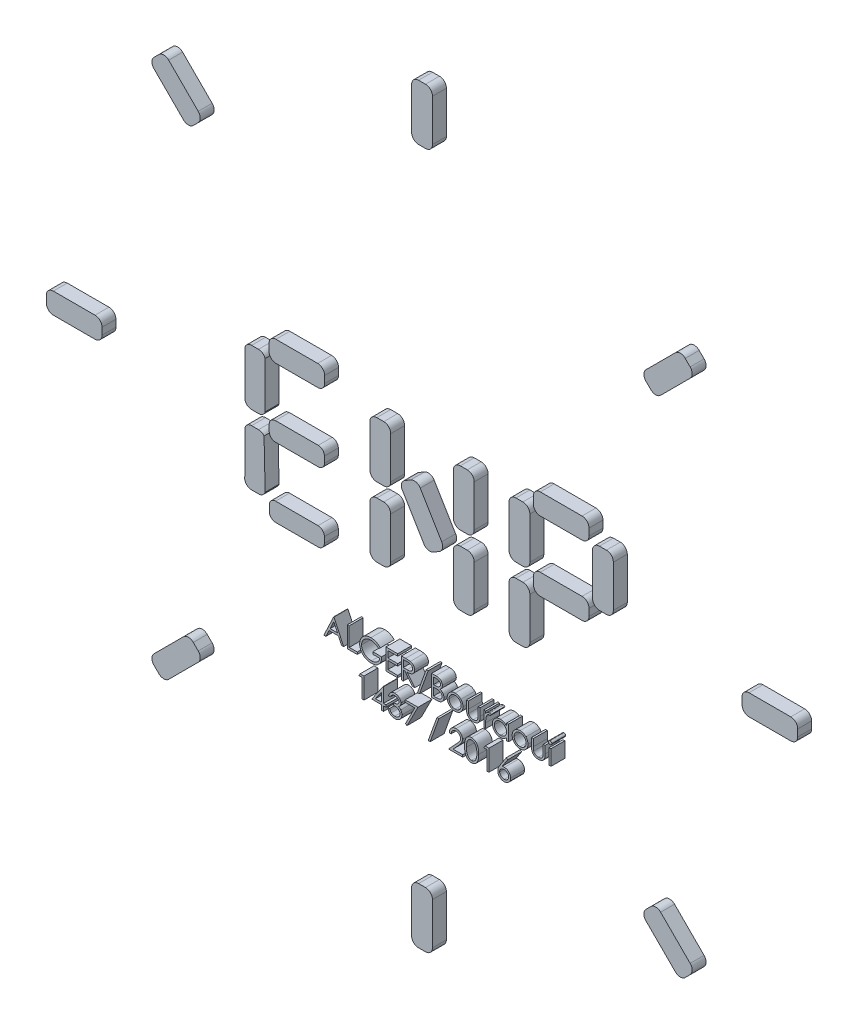
from build123d import *

# Parameters (mm, degrees)
BOSS_EXTRU_1_DEPTH    = 10
BOSS_EXTRU_1_2_DEPTH  = 10
BOSS_EXTRU_1_3_DEPTH  = 10
BOSS_EXTRU_1_4_DEPTH  = 10
BOSS_EXTRU_1_5_DEPTH  = 10
BOSS_EXTRU_1_6_DEPTH  = 10
BOSS_EXTRU_1_7_DEPTH  = 10
BOSS_EXTRU_1_8_DEPTH  = 10
BOSS_EXTRU_1_9_DEPTH  = 10
BOSS_EXTRU_1_10_DEPTH = 10
BOSS_EXTRU_1_11_DEPTH = 10
BOSS_EXTRU_1_12_DEPTH = 10
BOSS_EXTRU_1_13_DEPTH = 10
BOSS_EXTRU_1_14_DEPTH = 10
BOSS_EXTRU_1_15_DEPTH = 10
BOSS_EXTRU_1_16_DEPTH = 10
BOSS_EXTRU_1_17_DEPTH = 10
BOSS_EXTRU_1_18_DEPTH = 10
BOSS_EXTRU_1_19_DEPTH = 10
BOSS_EXTRU_1_20_DEPTH = 10
BOSS_EXTRU_1_21_DEPTH = 10
BOSS_EXTRU_1_22_DEPTH = 10
BOSS_EXTRU_1_23_DEPTH = 10
BOSS_EXTRU_2_DEPTH    = 10
BOSS_EXTRU_2_2_DEPTH  = 10
BOSS_EXTRU_2_3_DEPTH  = 10
BOSS_EXTRU_2_4_DEPTH  = 10
BOSS_EXTRU_2_5_DEPTH  = 10
BOSS_EXTRU_2_6_DEPTH  = 10
BOSS_EXTRU_2_7_DEPTH  = 10
BOSS_EXTRU_2_8_DEPTH  = 10
BOSS_EXTRU_2_9_DEPTH  = 10
BOSS_EXTRU_2_10_DEPTH = 10
BOSS_EXTRU_2_11_DEPTH = 10
BOSS_EXTRU_2_12_DEPTH = 10
BOSS_EXTRU_2_13_DEPTH = 10
BOSS_EXTRU_2_14_DEPTH = 10
ESQUISSE2_W           = 1.346153846
ESQUISSE2_H           = 10.961538462
BOSS_EXTRU_2_15_DEPTH = 10
BOSS_EXTRU_2_16_DEPTH = 10
BOSS_EXTRU_2_17_DEPTH = 10
BOSS_EXTRU_2_18_DEPTH = 10
BOSS_EXTRU_2_19_DEPTH = 10
BOSS_EXTRU_2_20_DEPTH = 10
BOSS_EXTRU_2_21_DEPTH = 10
BOSS_EXTRU_2_22_DEPTH = 10
BOSS_EXTRU_2_23_DEPTH = 10
BOSS_EXTRU_2_24_DEPTH = 10


with BuildPart() as part:
    # Esquisse1 → Boss.-Extru.1 (new body)
    with BuildSketch(Plane.XY):
        with BuildLine():
            ThreePointArc((160.86679272, -164.402326626), (159.402326626, -167.937860532), (160.86679272, -171.473394438))
            Line((160.86679272, -171.473394438), (182.079996156, -192.686597873))
            ThreePointArc((182.079996156, -192.686597873), (185.615530061, -194.151063967), (189.151063967, -192.686597873))
            Line((189.151063967, -192.686597873), (192.686597873, -189.151063967))
            ThreePointArc((192.686597873, -189.151063967), (194.151063967, -185.615530061), (192.686597873, -182.079996156))
            Line((192.686597873, -182.079996156), (171.473394438, -160.86679272))
            ThreePointArc((171.473394438, -160.86679272), (167.937860532, -159.402326626), (164.402326626, -160.86679272))
            Line((164.402326626, -160.86679272), (160.86679272, -164.402326626))
        make_face()
    extrude(amount=BOSS_EXTRU_1_DEPTH)


with BuildPart() as body_2:
    # Esquisse1 → Boss.-Extru.1 2 (new body)
    with BuildSketch(Plane.XY):
        with BuildLine():
            Line((-7.5, -235), (-7.5, -265))
            ThreePointArc((-7.5, -265), (-6.035533906, -268.535533906), (-2.5, -270))
            Line((-2.5, -270), (2.5, -270))
            ThreePointArc((2.5, -270), (6.035533906, -268.535533906), (7.5, -265))
            Line((7.5, -265), (7.5, -235))
            ThreePointArc((7.5, -235), (6.035533906, -231.464466094), (2.5, -230))
            Line((2.5, -230), (-2.5, -230))
            ThreePointArc((-2.5, -230), (-6.035533906, -231.464466094), (-7.5, -235))
        make_face()
    extrude(amount=BOSS_EXTRU_1_2_DEPTH)


with BuildPart() as body_3:
    # Esquisse1 → Boss.-Extru.1 3 (new body)
    with BuildSketch(Plane.XY):
        with BuildLine():
            Line((265, 7.5), (235, 7.5))
            ThreePointArc((235, 7.5), (231.464466094, 6.035533906), (230, 2.5))
            Line((230, 2.5), (230, -2.5))
            ThreePointArc((230, -2.5), (231.464466094, -6.035533906), (235, -7.5))
            Line((235, -7.5), (265, -7.5))
            ThreePointArc((265, -7.5), (268.535533906, -6.035533906), (270, -2.5))
            Line((270, -2.5), (270, 2.5))
            ThreePointArc((270, 2.5), (268.535533906, 6.035533906), (265, 7.5))
        make_face()
    extrude(amount=BOSS_EXTRU_1_3_DEPTH)


with BuildPart() as body_4:
    # Esquisse1 → Boss.-Extru.1 4 (new body)
    with BuildSketch(Plane.XY):
        with BuildLine():
            Line((-171.473394438, -160.86679272), (-192.686597873, -182.079996156))
            ThreePointArc((-192.686597873, -182.079996156), (-194.151063967, -185.615530061), (-192.686597873, -189.151063967))
            Line((-192.686597873, -189.151063967), (-189.151063967, -192.686597873))
            ThreePointArc((-189.151063967, -192.686597873), (-185.615530061, -194.151063967), (-182.079996156, -192.686597873))
            Line((-182.079996156, -192.686597873), (-160.86679272, -171.473394438))
            ThreePointArc((-160.86679272, -171.473394438), (-159.402326626, -167.937860532), (-160.86679272, -164.402326626))
            Line((-160.86679272, -164.402326626), (-164.402326626, -160.86679272))
            ThreePointArc((-164.402326626, -160.86679272), (-167.937860532, -159.402326626), (-171.473394438, -160.86679272))
        make_face()
    extrude(amount=BOSS_EXTRU_1_4_DEPTH)


with BuildPart() as body_5:
    # Esquisse1 → Boss.-Extru.1 5 (new body)
    with BuildSketch(Plane.XY):
        with BuildLine():
            Line((-235, 7.5), (-265, 7.5))
            ThreePointArc((-265, 7.5), (-268.535533906, 6.035533906), (-270, 2.5))
            Line((-270, 2.5), (-270, -2.5))
            ThreePointArc((-270, -2.5), (-268.535533906, -6.035533906), (-265, -7.5))
            Line((-265, -7.5), (-235, -7.5))
            ThreePointArc((-235, -7.5), (-231.464466094, -6.035533906), (-230, -2.5))
            Line((-230, -2.5), (-230, 2.5))
            ThreePointArc((-230, 2.5), (-231.464466094, 6.035533906), (-235, 7.5))
        make_face()
    extrude(amount=BOSS_EXTRU_1_5_DEPTH)


with BuildPart() as body_6:
    # Esquisse1 → Boss.-Extru.1 6 (new body)
    with BuildSketch(Plane.XY):
        with BuildLine():
            Line((182.079996156, 192.686597873), (160.86679272, 171.473394438))
            ThreePointArc((160.86679272, 171.473394438), (159.402326626, 167.937860532), (160.86679272, 164.402326626))
            Line((160.86679272, 164.402326626), (164.402326626, 160.86679272))
            ThreePointArc((164.402326626, 160.86679272), (167.937860532, 159.402326626), (171.473394438, 160.86679272))
            Line((171.473394438, 160.86679272), (192.686597873, 182.079996156))
            ThreePointArc((192.686597873, 182.079996156), (194.151063967, 185.615530061), (192.686597873, 189.151063967))
            Line((192.686597873, 189.151063967), (189.151063967, 192.686597873))
            ThreePointArc((189.151063967, 192.686597873), (185.615530061, 194.151063967), (182.079996156, 192.686597873))
        make_face()
    extrude(amount=BOSS_EXTRU_1_6_DEPTH)


with BuildPart() as body_7:
    # Esquisse1 → Boss.-Extru.1 7 (new body)
    with BuildSketch(Plane.XY):
        with BuildLine():
            Line((-160.86679272, 171.473394438), (-182.079996156, 192.686597873))
            ThreePointArc((-182.079996156, 192.686597873), (-185.615530061, 194.151063967), (-189.151063967, 192.686597873))
            Line((-189.151063967, 192.686597873), (-192.686597873, 189.151063967))
            ThreePointArc((-192.686597873, 189.151063967), (-194.151063967, 185.615530061), (-192.686597873, 182.079996156))
            Line((-192.686597873, 182.079996156), (-171.473394438, 160.86679272))
            ThreePointArc((-171.473394438, 160.86679272), (-167.937860532, 159.402326626), (-164.402326626, 160.86679272))
            Line((-164.402326626, 160.86679272), (-160.86679272, 164.402326626))
            ThreePointArc((-160.86679272, 164.402326626), (-159.402326626, 167.937860532), (-160.86679272, 171.473394438))
        make_face()
    extrude(amount=BOSS_EXTRU_1_7_DEPTH)


with BuildPart() as body_8:
    # Esquisse1 → Boss.-Extru.1 8 (new body)
    with BuildSketch(Plane.XY):
        with BuildLine():
            Line((-7.5, 265), (-7.5, 235))
            ThreePointArc((-7.5, 235), (-6.035533906, 231.464466094), (-2.5, 230))
            Line((-2.5, 230), (2.5, 230))
            ThreePointArc((2.5, 230), (6.035533906, 231.464466094), (7.5, 235))
            Line((7.5, 235), (7.5, 265))
            ThreePointArc((7.5, 265), (6.035533906, 268.535533906), (2.5, 270))
            Line((2.5, 270), (-2.5, 270))
            ThreePointArc((-2.5, 270), (-6.035533906, 268.535533906), (-7.5, 265))
        make_face()
    extrude(amount=BOSS_EXTRU_1_8_DEPTH)


with BuildPart() as body_9:
    # Esquisse1 → Boss.-Extru.1 9 (new body)
    with BuildSketch(Plane.XY):
        with BuildLine():
            ThreePointArc((-110, 47.5), (-108.535533906, 43.964466094), (-105, 42.5))
            Line((-105, 42.5), (-75, 42.5))
            ThreePointArc((-75, 42.5), (-71.464466094, 43.964466094), (-70, 47.5))
            Line((-70, 47.5), (-70, 52.5))
            ThreePointArc((-70, 52.5), (-71.464466094, 56.035533906), (-75, 57.5))
            Line((-75, 57.5), (-105, 57.5))
            ThreePointArc((-105, 57.5), (-108.535533906, 56.035533906), (-110, 52.5))
            Line((-110, 52.5), (-110, 47.5))
        make_face()
    extrude(amount=BOSS_EXTRU_1_9_DEPTH)


with BuildPart() as body_10:
    # Esquisse1 → Boss.-Extru.1 10 (new body)
    with BuildSketch(Plane.XY):
        with BuildLine():
            Line((-105.240790089, -56.635662406), (-74.759209911, -56.635662406))
            ThreePointArc((-74.759209911, -56.635662406), (-71.534256795, -55.299843088), (-70.198437477, -52.074889972))
            Line((-70.198437477, -52.074889972), (-70.198437477, -47.925110028))
            ThreePointArc((-70.198437477, -47.925110028), (-71.534256795, -44.700156912), (-74.759209911, -43.364337594))
            Line((-74.759209911, -43.364337594), (-105.240790089, -43.364337594))
            ThreePointArc((-105.240790089, -43.364337594), (-108.465743205, -44.700156912), (-109.801562523, -47.925110028))
            Line((-109.801562523, -47.925110028), (-109.801562523, -52.074889972))
            ThreePointArc((-109.801562523, -52.074889972), (-108.465743205, -55.299843088), (-105.240790089, -56.635662406))
        make_face()
    extrude(amount=BOSS_EXTRU_1_10_DEPTH)


with BuildPart() as body_11:
    # Esquisse1 → Boss.-Extru.1 11 (new body)
    with BuildSketch(Plane.XY):
        with BuildLine():
            Line((-105.397742041, -6.703997457), (-74.602257959, -6.703997457))
            ThreePointArc((-74.602257959, -6.703997457), (-71.468713678, -5.406040917), (-70.170757139, -2.272496636))
            Line((-70.170757139, -2.272496636), (-70.170757139, 2.272496636))
            ThreePointArc((-70.170757139, 2.272496636), (-71.468713678, 5.406040917), (-74.602257959, 6.703997457))
            Line((-74.602257959, 6.703997457), (-105.397742041, 6.703997457))
            ThreePointArc((-105.397742041, 6.703997457), (-108.531286322, 5.406040917), (-109.829242861, 2.272496636))
            Line((-109.829242861, 2.272496636), (-109.829242861, -2.272496636))
            ThreePointArc((-109.829242861, -2.272496636), (-108.531286322, -5.406040917), (-105.397742041, -6.703997457))
        make_face()
    extrude(amount=BOSS_EXTRU_1_11_DEPTH)


with BuildPart() as body_12:
    # Esquisse1 → Boss.-Extru.1 12 (new body)
    with BuildSketch(Plane.XY):
        with BuildLine():
            Line((-112.767134419, 8.387553599), (-112.767134419, 41.612446401))
            ThreePointArc((-112.767134419, 41.612446401), (-114.589865296, 44.065847513), (-117.5, 45))
            Line((-117.5, 45), (-122.5, 45))
            ThreePointArc((-122.5, 45), (-125.410134704, 44.065847513), (-127.232865581, 41.612446401))
            Line((-127.232865581, 41.612446401), (-127.232865581, 8.387553599))
            ThreePointArc((-127.232865581, 8.387553599), (-125.410134704, 5.934152487), (-122.5, 5))
            Line((-122.5, 5), (-117.5, 5))
            ThreePointArc((-117.5, 5), (-114.589865296, 5.934152487), (-112.767134419, 8.387553599))
        make_face()
    extrude(amount=BOSS_EXTRU_1_12_DEPTH)


with BuildPart() as body_13:
    # Esquisse1 → Boss.-Extru.1 13 (new body)
    with BuildSketch(Plane.XY):
        with BuildLine():
            Line((-112.767134419, -41.612446401), (-113.54267641, -6.94392572))
            ThreePointArc((-113.54267641, -6.94392572), (-115.29550135, -5.512218176), (-117.5, -5))
            Line((-117.5, -5), (-122.5, -5))
            ThreePointArc((-122.5, -5), (-125.410134704, -5.934152487), (-127.232865581, -8.387553599))
            Line((-127.232865581, -8.387553599), (-127.232865581, -38.387553599))
            ThreePointArc((-127.232865581, -38.387553599), (-126.565847513, -42.910134704), (-122.5, -45))
            Line((-122.5, -45), (-117.5, -45))
            ThreePointArc((-117.5, -45), (-114.589865296, -44.065847513), (-112.767134419, -41.612446401))
        make_face()
    extrude(amount=BOSS_EXTRU_1_13_DEPTH)


with BuildPart() as body_14:
    # Esquisse1 → Boss.-Extru.1 14 (new body)
    with BuildSketch(Plane.XY):
        with BuildLine():
            ThreePointArc((80, -2.5), (81.464466094, -6.035533906), (85, -7.5))
            Line((85, -7.5), (115, -7.5))
            ThreePointArc((115, -7.5), (118.535533906, -6.035533906), (120, -2.5))
            Line((120, -2.5), (120, 2.5))
            ThreePointArc((120, 2.5), (118.535533906, 6.035533906), (115, 7.5))
            Line((115, 7.5), (85, 7.5))
            ThreePointArc((85, 7.5), (81.464466094, 6.035533906), (80, 2.5))
            Line((80, 2.5), (80, -2.5))
        make_face()
    extrude(amount=BOSS_EXTRU_1_14_DEPTH)


with BuildPart() as body_15:
    # Esquisse1 → Boss.-Extru.1 15 (new body)
    with BuildSketch(Plane.XY):
        with BuildLine():
            ThreePointArc((80, 47.5), (81.464466094, 43.964466094), (85, 42.5))
            Line((85, 42.5), (115, 42.5))
            ThreePointArc((115, 42.5), (118.535533906, 43.964466094), (120, 47.5))
            Line((120, 47.5), (120, 52.5))
            ThreePointArc((120, 52.5), (118.535533906, 56.035533906), (115, 57.5))
            Line((115, 57.5), (85, 57.5))
            ThreePointArc((85, 57.5), (81.464466094, 56.035533906), (80, 52.5))
            Line((80, 52.5), (80, 47.5))
        make_face()
    extrude(amount=BOSS_EXTRU_1_15_DEPTH)


with BuildPart() as body_16:
    # Esquisse1 → Boss.-Extru.1 16 (new body)
    with BuildSketch(Plane.XY):
        with BuildLine():
            ThreePointArc((-12.433647423, 15.863619126), (-14.711881146, 12.788832622), (-14.148633274, 9.00367572))
            Line((-14.148633274, 9.00367572), (1.286239389, -16.721112051))
            ThreePointArc((1.286239389, -16.721112051), (4.361025892, -18.999345775), (8.146182794, -18.436097903))
            Line((8.146182794, -18.436097903), (12.433647423, -15.863619126))
            ThreePointArc((12.433647423, -15.863619126), (14.711881146, -12.788832622), (14.148633274, -9.00367572))
            Line((14.148633274, -9.00367572), (-1.286239389, 16.721112051))
            ThreePointArc((-1.286239389, 16.721112051), (-4.361025892, 18.999345775), (-8.146182794, 18.436097903))
            Line((-8.146182794, 18.436097903), (-12.433647423, 15.863619126))
        make_face()
    extrude(amount=BOSS_EXTRU_1_16_DEPTH)


with BuildPart() as body_17:
    # Esquisse1 → Boss.-Extru.1 17 (new body)
    with BuildSketch(Plane.XY):
        with BuildLine():
            Line((37.5, -40), (37.5, -10))
            ThreePointArc((37.5, -10), (36.035533906, -6.464466094), (32.5, -5))
            Line((32.5, -5), (27.5, -5))
            ThreePointArc((27.5, -5), (23.964466094, -6.464466094), (22.5, -10))
            Line((22.5, -10), (22.5, -40))
            ThreePointArc((22.5, -40), (23.964466094, -43.535533906), (27.5, -45))
            Line((27.5, -45), (32.5, -45))
            ThreePointArc((32.5, -45), (36.035533906, -43.535533906), (37.5, -40))
        make_face()
    extrude(amount=BOSS_EXTRU_1_17_DEPTH)


with BuildPart() as body_18:
    # Esquisse1 → Boss.-Extru.1 18 (new body)
    with BuildSketch(Plane.XY):
        with BuildLine():
            Line((37.5, 10), (37.5, 40))
            ThreePointArc((37.5, 40), (36.035533906, 43.535533906), (32.5, 45))
            Line((32.5, 45), (27.5, 45))
            ThreePointArc((27.5, 45), (23.964466094, 43.535533906), (22.5, 40))
            Line((22.5, 40), (22.5, 10))
            ThreePointArc((22.5, 10), (23.964466094, 6.464466094), (27.5, 5))
            Line((27.5, 5), (32.5, 5))
            ThreePointArc((32.5, 5), (36.035533906, 6.464466094), (37.5, 10))
        make_face()
    extrude(amount=BOSS_EXTRU_1_18_DEPTH)


with BuildPart() as body_19:
    # Esquisse1 → Boss.-Extru.1 19 (new body)
    with BuildSketch(Plane.XY):
        with BuildLine():
            Line((-22.5, -40), (-22.5, -10))
            ThreePointArc((-22.5, -10), (-23.964466094, -6.464466094), (-27.5, -5))
            Line((-27.5, -5), (-32.5, -5))
            ThreePointArc((-32.5, -5), (-36.035533906, -6.464466094), (-37.5, -10))
            Line((-37.5, -10), (-37.5, -40))
            ThreePointArc((-37.5, -40), (-36.035533906, -43.535533906), (-32.5, -45))
            Line((-32.5, -45), (-27.5, -45))
            ThreePointArc((-27.5, -45), (-23.964466094, -43.535533906), (-22.5, -40))
        make_face()
    extrude(amount=BOSS_EXTRU_1_19_DEPTH)


with BuildPart() as body_20:
    # Esquisse1 → Boss.-Extru.1 20 (new body)
    with BuildSketch(Plane.XY):
        with BuildLine():
            Line((-22.5, 10), (-22.5, 40))
            ThreePointArc((-22.5, 40), (-23.964466094, 43.535533906), (-27.5, 45))
            Line((-27.5, 45), (-32.5, 45))
            ThreePointArc((-32.5, 45), (-36.035533906, 43.535533906), (-37.5, 40))
            Line((-37.5, 40), (-37.5, 10))
            ThreePointArc((-37.5, 10), (-36.035533906, 6.464466094), (-32.5, 5))
            Line((-32.5, 5), (-27.5, 5))
            ThreePointArc((-27.5, 5), (-23.964466094, 6.464466094), (-22.5, 10))
        make_face()
    extrude(amount=BOSS_EXTRU_1_20_DEPTH)


with BuildPart() as body_21:
    # Esquisse1 → Boss.-Extru.1 21 (new body)
    with BuildSketch(Plane.XY):
        with BuildLine():
            Line((77.5, 10), (77.5, 40))
            ThreePointArc((77.5, 40), (76.035533906, 43.535533906), (72.5, 45))
            Line((72.5, 45), (67.5, 45))
            ThreePointArc((67.5, 45), (63.964466094, 43.535533906), (62.5, 40))
            Line((62.5, 40), (62.5, 10))
            ThreePointArc((62.5, 10), (63.964466094, 6.464466094), (67.5, 5))
            Line((67.5, 5), (72.5, 5))
            ThreePointArc((72.5, 5), (76.035533906, 6.464466094), (77.5, 10))
        make_face()
    extrude(amount=BOSS_EXTRU_1_21_DEPTH)


with BuildPart() as body_22:
    # Esquisse1 → Boss.-Extru.1 22 (new body)
    with BuildSketch(Plane.XY):
        with BuildLine():
            ThreePointArc((132.5, 5), (136.035533906, 6.464466094), (137.5, 10))
            Line((137.5, 10), (137.5, 40))
            ThreePointArc((137.5, 40), (136.035533906, 43.535533906), (132.5, 45))
            Line((132.5, 45), (127.5, 45))
            ThreePointArc((127.5, 45), (123.964466094, 43.535533906), (122.5, 40))
            Line((122.5, 40), (122.5, 10))
            ThreePointArc((122.5, 10), (123.964466094, 6.464466094), (127.5, 5))
            Line((127.5, 5), (132.5, 5))
        make_face()
    extrude(amount=BOSS_EXTRU_1_22_DEPTH)


with BuildPart() as body_23:
    # Esquisse1 → Boss.-Extru.1 23 (new body)
    with BuildSketch(Plane.XY):
        with BuildLine():
            ThreePointArc((72.5, -45), (76.035533906, -43.535533906), (77.5, -40))
            Line((77.5, -40), (77.5, -10))
            ThreePointArc((77.5, -10), (76.035533906, -6.464466094), (72.5, -5))
            Line((72.5, -5), (67.5, -5))
            ThreePointArc((67.5, -5), (63.964466094, -6.464466094), (62.5, -10))
            Line((62.5, -10), (62.5, -40))
            ThreePointArc((62.5, -40), (63.964466094, -43.535533906), (67.5, -45))
            Line((67.5, -45), (72.5, -45))
        make_face()
    extrude(amount=BOSS_EXTRU_1_23_DEPTH)


with BuildPart() as body_24:
    # Esquisse2 → Boss.-Extru.2 (new body)
    with BuildSketch(Plane.XY):
        Polygon((-63.281409309, -94.480059496), (-56.358332386, -109.480059496), (-57.821673732, -109.480059496), (-60.039221809, -104.672367188), (-66.839101616, -104.672367188), (-69.119750655, -109.480059496), (-70.589101616, -109.480059496), (-63.473717001, -94.480059496), align=None)
        Polygon((-63.392587193, -97.40373738), (-66.108933347, -103.13390565), (-60.748356424, -103.13390565), align=None, mode=Mode.SUBTRACT)
    extrude(amount=BOSS_EXTRU_2_DEPTH)


with BuildPart() as body_25:
    # Esquisse2 → Boss.-Extru.2 2 (new body)
    with BuildSketch(Plane.XY):
        Polygon((-53.666024693, -94.480059496), (-52.319870847, -94.480059496), (-52.319870847, -107.941597957), (-46.550640078, -107.941597957), (-46.550640078, -109.480059496), (-53.666024693, -109.480059496), align=None)
    extrude(amount=BOSS_EXTRU_2_2_DEPTH)


with BuildPart() as body_26:
    # Esquisse2 → Boss.-Extru.2 3 (new body)
    with BuildSketch(Plane.XY):
        with BuildLine():
            Line((-30.012178539, -97.04015565), (-31.166024693, -98.13390565))
            add(Edge.make_bspline(
                [(-31.166024693, -98.13390565), (-31.374819928, -97.937487665), (-31.787431556, -97.549335396), (-32.46011831, -97.045716845), (-33.161962456, -96.614290702), (-33.889301728, -96.263263974), (-34.624124102, -95.983180715), (-35.356676, -95.783774399), (-36.079443292, -95.656606382), (-36.560159942, -95.641399084), (-36.797034309, -95.63390565)],
                knots=[0, 0, 0, 0, 1.08915593, 2.152340314, 3.188132944, 4.216796309, 5.218260357, 6.173443236, 7.099959455, 8, 8, 8, 8], degree=3))
            add(Edge.make_bspline(
                [(-36.797034309, -95.63390565), (-36.942383023, -95.635678246), (-37.232703482, -95.639218842), (-37.663940385, -95.684408336), (-38.090654544, -95.749400611), (-38.512040436, -95.84343723), (-38.928917378, -95.962618913), (-39.339835487, -96.11169947), (-39.745561293, -96.28550766), (-40.142273069, -96.486346833), (-40.526875227, -96.706974746), (-40.890118808, -96.951468491), (-41.234319089, -97.211991876), (-41.553006626, -97.495067503), (-41.848014569, -97.798131211), (-42.126364735, -98.11554538), (-42.378267431, -98.455982031), (-42.605800995, -98.813177572), (-42.80877936, -99.180858383), (-42.987959304, -99.555485481), (-43.138375396, -99.935816286), (-43.257387347, -100.322328047), (-43.355575864, -100.712030576), (-43.424651323, -101.107622235), (-43.463594418, -101.509526601), (-43.470330618, -101.778657708), (-43.473717001, -101.913953727)],
                knots=[0, 0, 0, 0, 1.02818874, 2.053710826, 3.065248034, 4.081641283, 5.106893873, 6.131558223, 7.173050175, 8.228653731, 9.27666206, 10.308777013, 11.325269123, 12.329503258, 13.32196095, 14.316845687, 15.314881793, 16.315733098, 17.311955233, 18.285320748, 19.252783886, 20.203351036, 21.145449891, 22.095197417, 23.042428769, 24, 24, 24, 24], degree=3))
            add(Edge.make_bspline(
                [(-43.473717001, -101.913953727), (-43.470478208, -102.052257229), (-43.464009467, -102.328486573), (-43.422608098, -102.740746884), (-43.345772782, -103.146884323), (-43.243054029, -103.548233465), (-43.114564819, -103.94548167), (-42.95439625, -104.336906712), (-42.764686534, -104.722494103), (-42.545101311, -105.098769604), (-42.304303296, -105.465296847), (-42.034547235, -105.81055194), (-41.748001877, -106.139132414), (-41.434228021, -106.443742831), (-41.103287125, -106.732530958), (-40.745291657, -106.997540337), (-40.367281112, -107.24387558), (-39.968678775, -107.468432091), (-39.553809708, -107.669040102), (-39.128423623, -107.847428228), (-38.691161556, -107.994339673), (-38.244321457, -108.114074405), (-37.788436007, -108.212218536), (-37.321191139, -108.275357737), (-36.846022388, -108.321175584), (-36.525713965, -108.324525599), (-36.364342001, -108.326213342)],
                knots=[0, 0, 0, 0, 0.93586088, 1.869166235, 2.799637598, 3.729985548, 4.670839027, 5.622275134, 6.589130586, 7.576015415, 8.568469353, 9.55398029, 10.53834874, 11.515998671, 12.510579167, 13.508179873, 14.527009472, 15.561807829, 16.601455013, 17.643573243, 18.680854198, 19.719860599, 20.772568776, 21.833555941, 22.908541556, 24, 24, 24, 24], degree=3))
            add(Edge.make_bspline(
                [(-36.364342001, -108.326213342), (-36.16986337, -108.322148015), (-35.787972982, -108.314165085), (-35.226602513, -108.252020987), (-34.687446496, -108.1549633), (-34.17201991, -108.012823743), (-33.679724107, -107.831522279), (-33.208754359, -107.612970622), (-32.762818679, -107.348786084), (-32.340576506, -107.050612367), (-31.95161714, -106.718405943), (-31.600813751, -106.359929706), (-31.293761654, -105.976923706), (-31.025884372, -105.571643783), (-30.804275853, -105.140735333), (-30.62237816, -104.686310066), (-30.482949767, -104.208163586), (-30.425714161, -103.877770879), (-30.396793924, -103.710828727)],
                knots=[0, 0, 0, 0, 1.13008108, 2.219097802, 3.278683437, 4.311054135, 5.322181354, 6.324827112, 7.324222904, 8.330512327, 9.32562643, 10.293043162, 11.24128371, 12.174520618, 13.111833804, 14.052305215, 15.015860969, 16, 16, 16, 16], degree=3))
            Line((-30.396793924, -103.710828727), (-35.396793924, -103.710828727))
            Line((-35.396793924, -103.710828727), (-35.396793924, -102.172367188))
            Line((-35.396793924, -102.172367188), (-29.050640078, -102.172367188))
            add(Edge.make_bspline(
                [(-29.050640078, -102.172367188), (-29.057950857, -102.459113569), (-29.072259371, -103.020328033), (-29.172626153, -103.838772051), (-29.33469692, -104.611793594), (-29.556098256, -105.340206758), (-29.8427066, -106.022979299), (-30.191446008, -106.660804439), (-30.607897955, -107.249561643), (-31.077228419, -107.794057373), (-31.603942524, -108.279753996), (-32.173808038, -108.706636588), (-32.787766474, -109.066219225), (-33.445237077, -109.358764921), (-34.144067506, -109.587082042), (-34.885874848, -109.748960228), (-35.669653137, -109.845945785), (-36.206810323, -109.858337411), (-36.481529501, -109.86467488)],
                knots=[0, 0, 0, 0, 1.140356446, 2.231883559, 3.274166699, 4.278491846, 5.25512956, 6.21435461, 7.1637429, 8.11826594, 9.068280886, 10.0076534, 10.945064095, 11.891975133, 12.864533718, 13.863980011, 14.907571808, 16, 16, 16, 16], degree=3))
            add(Edge.make_bspline(
                [(-36.481529501, -109.86467488), (-36.650858653, -109.862235789), (-36.984830313, -109.857425116), (-37.478077148, -109.823236484), (-37.957724093, -109.770605443), (-38.423701274, -109.691126342), (-38.877722741, -109.593777824), (-39.317520962, -109.469120458), (-39.744771285, -109.324826032), (-40.16013408, -109.160701717), (-40.559839281, -108.970537475), (-40.945667211, -108.759210448), (-41.319750607, -108.527810331), (-41.679541314, -108.272335278), (-42.026913977, -107.994696163), (-42.359628736, -107.69433651), (-42.679548213, -107.372174568), (-42.8799502, -107.143407384), (-42.980928539, -107.028136419)],
                knots=[0, 0, 0, 0, 1.107784379, 2.184907829, 3.233506516, 4.263428166, 5.276301166, 6.270063455, 7.25232949, 8.225834625, 9.190232166, 10.146266622, 11.1027726, 12.066435141, 13.031522626, 14.010570082, 14.99756817, 16, 16, 16, 16], degree=3))
            add(Edge.make_bspline(
                [(-42.980928539, -107.028136419), (-43.127439676, -106.845262192), (-43.418030016, -106.482549261), (-43.792079259, -105.901406642), (-44.110942414, -105.299684384), (-44.369661652, -104.675707405), (-44.571682022, -104.03005935), (-44.716565962, -103.363565245), (-44.801454344, -102.675366829), (-44.81368379, -102.209658551), (-44.819870847, -101.97404988)],
                knots=[0, 0, 0, 0, 1.023165419, 2.029347347, 3.013907458, 3.994755782, 4.975994455, 5.96558838, 6.970761222, 8, 8, 8, 8], degree=3))
            add(Edge.make_bspline(
                [(-44.819870847, -101.97404988), (-44.817589827, -101.797623083), (-44.813056776, -101.447011766), (-44.758090278, -100.926480448), (-44.679227058, -100.415191767), (-44.56331111, -99.913563669), (-44.417184261, -99.421261133), (-44.234812178, -98.938055573), (-44.02247691, -98.463661838), (-43.775681926, -98.001345261), (-43.501034243, -97.557240634), (-43.20296187, -97.133135763), (-42.877232154, -96.736754056), (-42.529164442, -96.363075563), (-42.154605913, -96.01679479), (-41.757065526, -95.694705745), (-41.336236913, -95.396376377), (-40.890796142, -95.126505657), (-40.42739178, -94.88409014), (-39.947134631, -94.671564947), (-39.450171298, -94.495922167), (-38.940224966, -94.346891683), (-38.413435677, -94.236683937), (-37.873626233, -94.156760743), (-37.317982896, -94.102072458), (-36.942399913, -94.097674219), (-36.751962193, -94.095444111)],
                knots=[0, 0, 0, 0, 1.008945113, 2.00506715, 2.99143336, 3.967273523, 4.948097931, 5.927297278, 6.919902385, 7.919676788, 8.923139349, 9.905703106, 10.883022732, 11.856032218, 12.825136022, 13.798837087, 14.781400844, 15.773989409, 16.776158564, 17.77167057, 18.775803737, 19.789618931, 20.80898985, 21.851988756, 22.910860228, 24, 24, 24, 24], degree=3))
            add(Edge.make_bspline(
                [(-36.751962193, -94.095444111), (-36.596655435, -94.097927647), (-36.288700383, -94.102852207), (-35.830447245, -94.136986413), (-35.379277182, -94.191088761), (-34.934521225, -94.264917846), (-34.497693941, -94.36547652), (-34.067550918, -94.485812026), (-33.64346862, -94.625919837), (-33.226776123, -94.793014892), (-32.814671626, -94.982673285), (-32.404863738, -95.196159381), (-31.998752684, -95.437123687), (-31.595634192, -95.706281696), (-31.19296623, -95.99901063), (-30.797117763, -96.323682731), (-30.398533716, -96.667494542), (-30.142240226, -96.914703901), (-30.012178539, -97.04015565)],
                knots=[0, 0, 0, 0, 0.985871117, 1.954866573, 2.915460327, 3.869826059, 4.81536089, 5.759505086, 6.70452669, 7.649098992, 8.607881297, 9.583363685, 10.581137262, 11.603961102, 12.659522466, 13.73993555, 14.853081303, 16, 16, 16, 16], degree=3))
        make_face()
    extrude(amount=BOSS_EXTRU_2_3_DEPTH)


with BuildPart() as body_27:
    # Esquisse2 → Boss.-Extru.2 4 (new body)
    with BuildSketch(Plane.XY):
        Polygon((-25.973717001, -94.480059496), (-17.512178539, -94.480059496), (-17.512178539, -96.018521034), (-24.627563155, -96.018521034), (-24.627563155, -100.63390565), (-17.512178539, -100.63390565), (-17.512178539, -102.172367188), (-24.627563155, -102.172367188), (-24.627563155, -107.941597957), (-17.512178539, -107.941597957), (-17.512178539, -109.480059496), (-25.973717001, -109.480059496), align=None)
    extrude(amount=BOSS_EXTRU_2_4_DEPTH)


with BuildPart() as body_28:
    # Esquisse2 → Boss.-Extru.2 5 (new body)
    with BuildSketch(Plane.XY):
        with BuildLine():
            Line((-14.819870847, -94.480059496), (-11.818067963, -94.480059496))
            add(Edge.make_bspline(
                [(-11.818067963, -94.480059496), (-11.61774884, -94.480726293), (-11.233113936, -94.482006617), (-10.682085634, -94.489145601), (-10.181398076, -94.509607125), (-9.73131305, -94.52721534), (-9.331838814, -94.55932366), (-8.981750425, -94.590012148), (-8.682660293, -94.63018498), (-8.501606645, -94.667493935), (-8.419630463, -94.684386419)],
                knots=[0, 0, 0, 0, 1.410062039, 2.707475311, 3.878576406, 4.937260626, 5.877586885, 6.699081471, 7.410979367, 8, 8, 8, 8], degree=3))
            add(Edge.make_bspline(
                [(-8.419630463, -94.684386419), (-8.309887788, -94.711501128), (-8.092743547, -94.765152115), (-7.780100407, -94.878550404), (-7.482181876, -95.009777367), (-7.200225486, -95.163907596), (-6.935643523, -95.342085224), (-6.685707906, -95.54123432), (-6.449284491, -95.760265202), (-6.235934648, -96.004700237), (-6.034767283, -96.261142421), (-5.865101741, -96.538444236), (-5.718845399, -96.828422211), (-5.602400327, -97.13402543), (-5.508637583, -97.452290167), (-5.442525129, -97.786099296), (-5.402877182, -98.133932046), (-5.398840658, -98.371180226), (-5.396793924, -98.491477765)],
                knots=[0, 0, 0, 0, 1.027469482, 2.033020251, 3.019912614, 3.986113645, 4.951240523, 5.91722682, 6.890402269, 7.87763091, 8.8651537, 9.85103654, 10.82876324, 11.815024772, 12.821070561, 13.842952187, 14.906261191, 16, 16, 16, 16], degree=3))
            add(Edge.make_bspline(
                [(-5.396793924, -98.491477765), (-5.40308963, -98.691342499), (-5.415374184, -99.081330361), (-5.529910342, -99.647305567), (-5.717523998, -100.175259773), (-5.97605238, -100.664528221), (-6.305278704, -101.105573844), (-6.70095638, -101.49296151), (-7.163306144, -101.817132564), (-7.593717498, -102.041930298), (-7.973921211, -102.185899907), (-8.286921123, -102.287198587), (-8.628351026, -102.365464153), (-8.994939603, -102.435579003), (-9.388212413, -102.488514837), (-9.807226867, -102.527285956), (-10.252281803, -102.551517593), (-10.558020671, -102.555126185), (-10.715303539, -102.556982573)],
                knots=[0, 0, 0, 0, 1.260483769, 2.459530307, 3.627416485, 4.787058657, 5.939039949, 7.08810263, 8.267026773, 9.491475466, 10.141966685, 10.831826277, 11.566392101, 12.351337768, 13.187381173, 14.07005841, 15.007169909, 16, 16, 16, 16], degree=3))
            Line((-10.715303539, -102.556982573), (-5.204486232, -109.480059496))
            Line((-5.204486232, -109.480059496), (-6.869149693, -109.480059496))
            Line((-6.869149693, -109.480059496), (-12.379967001, -102.556982573))
            Line((-12.379967001, -102.556982573), (-13.473717001, -102.556982573))
            Line((-13.473717001, -102.556982573), (-13.473717001, -109.480059496))
            Line((-13.473717001, -109.480059496), (-14.819870847, -109.480059496))
            Line((-14.819870847, -109.480059496), (-14.819870847, -94.480059496))
        make_face()
        with BuildLine():
            Line((-13.473717001, -96.018521034), (-13.473717001, -101.018521034))
            Line((-13.473717001, -101.018521034), (-10.72732277, -101.039554688))
            add(Edge.make_bspline(
                [(-10.72732277, -101.039554688), (-10.599094032, -101.039611417), (-10.350550216, -101.039721373), (-9.990975938, -101.022605189), (-9.656175459, -101.003133825), (-9.347429379, -100.973350915), (-9.06459977, -100.934967751), (-8.807827999, -100.886954961), (-8.57669492, -100.83101755), (-8.307129755, -100.744439154), (-8.006116049, -100.607270504), (-7.678981221, -100.407704081), (-7.400399774, -100.15669357), (-7.165037507, -99.869664473), (-6.975911372, -99.554080549), (-6.842573996, -99.213724681), (-6.757963529, -98.857189261), (-6.747984048, -98.612140228), (-6.74294777, -98.488472957)],
                knots=[0, 0, 0, 0, 1.146690395, 2.22261258, 3.21895312, 4.145990853, 4.996080663, 5.770904154, 6.481378293, 7.121626537, 8.300444488, 9.431385265, 10.535395872, 11.636531494, 12.74115979, 13.810798291, 14.895190096, 16, 16, 16, 16], degree=3))
            add(Edge.make_bspline(
                [(-6.74294777, -98.488472957), (-6.748099718, -98.367844784), (-6.758308998, -98.128803761), (-6.841660863, -97.77884986), (-6.982615354, -97.448562931), (-7.172567803, -97.139286567), (-7.403992753, -96.858547699), (-7.675354807, -96.618345614), (-7.979234215, -96.420133623), (-8.263253636, -96.293471992), (-8.517114547, -96.215815478), (-8.737527376, -96.161167633), (-8.986576566, -96.117262766), (-9.265471389, -96.082085363), (-9.573021235, -96.051849887), (-9.910781168, -96.031485121), (-10.276510226, -96.019425704), (-10.529997074, -96.018829609), (-10.661217001, -96.018521034)],
                knots=[0, 0, 0, 0, 1.101028733, 2.181837193, 3.264309656, 4.369019818, 5.486613113, 6.575447106, 7.666700264, 8.788928104, 9.402425223, 10.0903467, 10.862060571, 11.710948788, 12.657782767, 13.684531032, 14.801375019, 16, 16, 16, 16], degree=3))
            Line((-10.661217001, -96.018521034), (-13.473717001, -96.018521034))
        make_face(mode=Mode.SUBTRACT)
    extrude(amount=BOSS_EXTRU_2_5_DEPTH)


with BuildPart() as body_29:
    # Esquisse2 → Boss.-Extru.2 6 (new body)
    with BuildSketch(Plane.XY):
        Polygon((4.410898384, -94.095444111), (-1.863140078, -111.595444111), (-3.281409309, -111.595444111), (2.992629153, -94.095444111), align=None)
    extrude(amount=BOSS_EXTRU_2_6_DEPTH)


with BuildPart() as body_30:
    # Esquisse2 → Boss.-Extru.2 7 (new body)
    with BuildSketch(Plane.XY):
        with BuildLine():
            Line((6.910898384, -94.480059496), (9.837581076, -94.480059496))
            add(Edge.make_bspline(
                [(9.837581076, -94.480059496), (9.980845982, -94.480812712), (10.258529027, -94.482272632), (10.662326635, -94.504914622), (11.040535823, -94.535787493), (11.393266276, -94.584773605), (11.720355001, -94.643881221), (12.022787732, -94.715460433), (12.299602756, -94.801288777), (12.630085912, -94.93777284), (13.006888744, -95.140586418), (13.414881856, -95.440280269), (13.763757167, -95.806847968), (14.06455567, -96.220345063), (14.303703325, -96.675212656), (14.476714599, -97.160609179), (14.586248351, -97.670273787), (14.597513069, -98.020173121), (14.603206076, -98.197006611)],
                knots=[0, 0, 0, 0, 1.001505555, 1.941167018, 2.826882275, 3.653841531, 4.429895133, 5.150066043, 5.825578002, 6.45369114, 7.647487171, 8.808567382, 9.977351308, 11.170798116, 12.373658725, 13.556498008, 14.765093433, 16, 16, 16, 16], degree=3))
            add(Edge.make_bspline(
                [(14.603206076, -98.197006611), (14.598520854, -98.362660421), (14.589313951, -98.68818578), (14.501273554, -99.164303391), (14.363442118, -99.6175229), (14.171848193, -100.046190266), (13.922839638, -100.440620037), (13.627732558, -100.803994034), (13.271689119, -101.120927136), (13.004932376, -101.298111004), (12.869432037, -101.38811238)],
                knots=[0, 0, 0, 0, 1.044552857, 2.05264487, 3.044412934, 4.028983338, 5.005914585, 5.980388656, 6.974128949, 8, 8, 8, 8], degree=3))
            add(Edge.make_bspline(
                [(12.869432037, -101.38811238), (13.03983387, -101.453533804), (13.365854787, -101.578701195), (13.814509126, -101.79999604), (14.201058462, -102.040690799), (14.528474802, -102.303541586), (14.808493323, -102.58686506), (15.05300593, -102.89481555), (15.261640391, -103.231410227), (15.440410063, -103.593139664), (15.579904732, -103.976310243), (15.684372893, -104.377327854), (15.744233389, -104.79475452), (15.752751852, -105.078834717), (15.75705223, -105.222246996)],
                knots=[0, 0, 0, 0, 1.27268992, 2.434971085, 3.483601985, 4.442670788, 5.356604649, 6.2567628, 7.179492994, 8.113709626, 9.066344395, 10.018646069, 10.999752585, 12, 12, 12, 12], degree=3))
            add(Edge.make_bspline(
                [(15.75705223, -105.222246996), (15.752865747, -105.368676448), (15.744628724, -105.656780497), (15.683857417, -106.080016788), (15.580961244, -106.484480845), (15.439227759, -106.87278877), (15.254246411, -107.244189347), (15.029126564, -107.599103335), (14.760705577, -107.933964752), (14.460436139, -108.252494565), (14.120741229, -108.538899368), (13.754245137, -108.793966683), (13.356332337, -109.00373552), (12.933538077, -109.179947041), (12.48111958, -109.31454932), (12.001108405, -109.408717494), (11.49391854, -109.472167653), (11.14587675, -109.477384245), (10.967388768, -109.480059496)],
                knots=[0, 0, 0, 0, 0.978564426, 1.925352924, 2.850884081, 3.763762016, 4.682927383, 5.618979971, 6.567305752, 7.547517671, 8.540179244, 9.531824382, 10.526200242, 11.540722885, 12.589160233, 13.674978461, 14.80764778, 16, 16, 16, 16], degree=3))
            Line((10.967388768, -109.480059496), (6.910898384, -109.480059496))
            Line((6.910898384, -109.480059496), (6.910898384, -94.480059496))
        make_face()
        with BuildLine():
            Line((8.25705223, -96.018521034), (8.25705223, -100.826213342))
            Line((8.25705223, -100.826213342), (9.161499345, -100.826213342))
            add(Edge.make_bspline(
                [(9.161499345, -100.826213342), (9.293708468, -100.824499386), (9.549163436, -100.821187674), (9.91910585, -100.811701173), (10.262498785, -100.785138129), (10.578749499, -100.758582721), (10.867359973, -100.715405916), (11.127690808, -100.664011104), (11.363827652, -100.609655796), (11.63613999, -100.517215138), (11.945024055, -100.38059653), (12.274308787, -100.168574376), (12.564599371, -99.916041433), (12.809730175, -99.624651597), (13.010350763, -99.303796515), (13.149695257, -98.958595599), (13.244183617, -98.597652176), (13.252718752, -98.349859664), (13.25705223, -98.22404988)],
                knots=[0, 0, 0, 0, 1.156816544, 2.235205308, 3.236616184, 4.169592532, 5.011045266, 5.787822928, 6.49130361, 7.128639758, 8.301311294, 9.436451833, 10.541879658, 11.654887649, 12.756523258, 13.837046038, 14.901820046, 16, 16, 16, 16], degree=3))
            add(Edge.make_bspline(
                [(13.25705223, -98.22404988), (13.254797172, -98.140796574), (13.250373629, -97.977486122), (13.21414519, -97.739417461), (13.152569871, -97.515515665), (13.073480043, -97.302712335), (12.962957091, -97.107661548), (12.832827962, -96.923619281), (12.675603576, -96.756853059), (12.496643664, -96.60098378), (12.290892423, -96.462792947), (12.058472601, -96.341761105), (11.7962397, -96.244300633), (11.508613178, -96.158945694), (11.19116566, -96.098995863), (10.847560431, -96.049052773), (10.474983064, -96.023626736), (10.217218339, -96.020260895), (10.083975307, -96.018521034)],
                knots=[0, 0, 0, 0, 0.91205012, 1.789085906, 2.630437955, 3.453916878, 4.269457761, 5.079663411, 5.91843418, 6.774407191, 7.675494373, 8.627863946, 9.638891023, 10.736472738, 11.911756761, 13.175263542, 14.539845004, 16, 16, 16, 16], degree=3))
            Line((10.083975307, -96.018521034), (8.25705223, -96.018521034))
        make_face(mode=Mode.SUBTRACT)
        with BuildLine():
            Line((8.25705223, -102.36467488), (8.25705223, -107.941597957))
            Line((8.25705223, -107.941597957), (10.174119537, -107.941597957))
            add(Edge.make_bspline(
                [(10.174119537, -107.941597957), (10.311343506, -107.939953326), (10.575824614, -107.936783515), (10.957687029, -107.926435424), (11.311614616, -107.902897099), (11.635992341, -107.865843458), (11.934322852, -107.825650104), (12.203027294, -107.771601758), (12.444283837, -107.709677641), (12.72403087, -107.61395976), (13.039045906, -107.465260599), (13.378521005, -107.241056771), (13.680347654, -106.973956881), (13.936655908, -106.664824392), (14.146711573, -106.328690133), (14.299520666, -105.972352919), (14.393767195, -105.601700659), (14.405176492, -105.348986177), (14.410898384, -105.222246996)],
                knots=[0, 0, 0, 0, 1.160039823, 2.235823828, 3.228722157, 4.157150951, 4.99529583, 5.772374946, 6.472645482, 7.099169577, 8.269452708, 9.405989375, 10.527446681, 11.663510218, 12.788923519, 13.866172445, 14.929861265, 16, 16, 16, 16], degree=3))
            add(Edge.make_bspline(
                [(14.410898384, -105.222246996), (14.409715079, -105.142989822), (14.407367558, -104.9857539), (14.371964922, -104.754686104), (14.320476909, -104.530860932), (14.253913621, -104.313670616), (14.156973047, -104.10704186), (14.04380214, -103.906888034), (13.911110419, -103.71294455), (13.704349708, -103.467749178), (13.403612632, -103.185247695), (12.97629788, -102.908658399), (12.490416603, -102.685596369), (12.138013062, -102.590884327), (11.955970499, -102.541958534)],
                knots=[0, 0, 0, 0, 0.723448775, 1.435228256, 2.130040452, 2.821711965, 3.505591119, 4.210454504, 4.921174351, 5.648778258, 7.137944449, 8.670945889, 10.280296675, 12, 12, 12, 12], degree=3))
            add(Edge.make_bspline(
                [(11.955970499, -102.541958534), (11.88298866, -102.527151032), (11.724748978, -102.495045311), (11.466716491, -102.461155154), (11.172134195, -102.43096204), (10.840321864, -102.408628507), (10.470859688, -102.385543321), (10.062958608, -102.376565516), (9.618284402, -102.365854401), (9.309745664, -102.365078112), (9.149480114, -102.36467488)],
                knots=[0, 0, 0, 0, 0.634451884, 1.375622551, 2.216452059, 3.157844607, 4.20941857, 5.370758133, 6.634282058, 8, 8, 8, 8], degree=3))
            Line((9.149480114, -102.36467488), (8.25705223, -102.36467488))
        make_face(mode=Mode.SUBTRACT)
    extrude(amount=BOSS_EXTRU_2_7_DEPTH)


with BuildPart() as body_31:
    # Esquisse2 → Boss.-Extru.2 8 (new body)
    with BuildSketch(Plane.XY):
        with BuildLine():
            add(Edge.make_bspline(
                [(23.743831076, -98.326213342), (23.94950796, -98.330592875), (24.352790063, -98.33918007), (24.943395289, -98.430958494), (25.507160157, -98.571304342), (26.046243838, -98.765325322), (26.553742247, -99.025390824), (27.037047579, -99.335716358), (27.49483476, -99.703356045), (27.769219171, -99.987747766), (27.908494537, -100.132102765)],
                knots=[0, 0, 0, 0, 1.054011418, 2.066658804, 3.057071809, 4.030435133, 4.997543892, 5.974964718, 6.972108034, 8, 8, 8, 8], degree=3))
            add(Edge.make_bspline(
                [(27.908494537, -100.132102765), (28.028417198, -100.270162704), (28.265941685, -100.543610742), (28.570509051, -100.986991941), (28.832887166, -101.4461638), (29.043156999, -101.927223772), (29.208949957, -102.425972362), (29.326660084, -102.944123839), (29.396675519, -103.480533898), (29.406116806, -103.844836061), (29.410898384, -104.029338342)],
                knots=[0, 0, 0, 0, 1.025258237, 2.030674902, 3.01204498, 3.988269485, 4.97094183, 5.956517959, 6.965070386, 8, 8, 8, 8], degree=3))
            add(Edge.make_bspline(
                [(29.410898384, -104.029338342), (29.406692652, -104.214910018), (29.398381931, -104.581608303), (29.319766432, -105.1216913), (29.19749035, -105.645383397), (29.022496758, -106.150492084), (28.798104861, -106.638561345), (28.524287628, -107.107459413), (28.199123555, -107.558111413), (27.830534997, -107.98669072), (27.423169814, -108.381688783), (26.981243464, -108.725952795), (26.513440462, -109.020902186), (26.013540377, -109.258486824), (25.48610829, -109.445814111), (24.93000657, -109.57738561), (24.346099126, -109.656935683), (23.947411034, -109.667150997), (23.743831076, -109.672367188)],
                knots=[0, 0, 0, 0, 0.998656419, 1.973391657, 2.932242238, 3.890759089, 4.846373663, 5.82037756, 6.809684879, 7.83454468, 8.860553229, 9.859544525, 10.845671541, 11.83227036, 12.833544569, 13.85385346, 14.904124723, 16, 16, 16, 16], degree=3))
            add(Edge.make_bspline(
                [(23.743831076, -109.672367188), (23.539253707, -109.66713349), (23.138578594, -109.656883028), (22.5526101, -109.577694673), (21.995511733, -109.445874748), (21.467389168, -109.257871208), (20.965339824, -109.020894592), (20.494826265, -108.726844494), (20.052540913, -108.381586685), (19.645089551, -107.986718384), (19.2765241, -107.558104285), (18.951354064, -107.107461263), (18.67753838, -106.638560863), (18.453146078, -106.150492213), (18.278152594, -105.645383362), (18.155876483, -105.121691309), (18.077260992, -104.581608301), (18.068950269, -104.214910017), (18.064744537, -104.029338342)],
                knots=[0, 0, 0, 0, 1.099876186, 2.154163076, 3.173186993, 4.173200201, 5.163417411, 6.152872554, 7.150605724, 8.17532212, 9.198891216, 10.186952605, 11.159729845, 12.11414092, 13.071450619, 14.029093627, 15.002601286, 16, 16, 16, 16], degree=3))
            add(Edge.make_bspline(
                [(18.064744537, -104.029338342), (18.069558725, -103.84583886), (18.079089988, -103.482541421), (18.149035027, -102.947139732), (18.266285983, -102.429865208), (18.432277682, -101.933041739), (18.644485643, -101.45408987), (18.903176877, -100.993783452), (19.210851017, -100.552407164), (19.447430809, -100.279312535), (19.567148384, -100.141117188)],
                knots=[0, 0, 0, 0, 1.031353054, 2.041901799, 3.029428768, 4.008703097, 4.981709435, 5.96992636, 6.972712378, 8, 8, 8, 8], degree=3))
            add(Edge.make_bspline(
                [(19.567148384, -100.141117188), (19.706213774, -99.995510306), (19.979710333, -99.70914875), (20.439776309, -99.34258079), (20.921892685, -99.025797616), (21.434999512, -98.77089955), (21.973640331, -98.570163046), (22.540294228, -98.430596552), (23.13290358, -98.339510745), (23.538159099, -98.330689983), (23.743831076, -98.326213342)],
                knots=[0, 0, 0, 0, 1.027980169, 2.021703884, 2.998553061, 3.971491411, 4.943284454, 5.930300938, 6.949603206, 8, 8, 8, 8], degree=3))
        make_face()
        with BuildLine():
            add(Edge.make_bspline(
                [(23.737821461, -99.672367188), (23.592374555, -99.676501152), (23.305235432, -99.684662363), (22.882580069, -99.746736241), (22.475693695, -99.845082687), (22.083804363, -99.984814356), (21.708233624, -100.165238209), (21.3486219, -100.386845467), (21.003911443, -100.646700995), (20.680845457, -100.944398159), (20.384349833, -101.26959385), (20.125158505, -101.616086816), (19.904765192, -101.978256872), (19.721164511, -102.356480634), (19.584419419, -102.754590979), (19.485106466, -103.168079399), (19.423091149, -103.597788326), (19.41500667, -103.889906976), (19.410898384, -104.038352765)],
                knots=[0, 0, 0, 0, 1.021534396, 2.016698045, 2.994645724, 3.958388632, 4.93408049, 5.916473867, 6.921342795, 7.962252576, 8.998418191, 10.008913653, 10.997312074, 11.973003931, 12.956656626, 13.948281152, 14.957379055, 16, 16, 16, 16], degree=3))
            add(Edge.make_bspline(
                [(19.410898384, -104.038352765), (19.417784771, -104.230147167), (19.431452961, -104.610823191), (19.542603974, -105.171442288), (19.728545174, -105.709650225), (19.979633516, -106.22229188), (20.294231596, -106.696601643), (20.664890453, -107.119479433), (21.087632026, -107.484561482), (21.557417027, -107.787479392), (22.064649818, -108.028164059), (22.601462622, -108.198731098), (23.161351311, -108.309609779), (23.543983016, -108.320630384), (23.737821461, -108.326213342)],
                knots=[0, 0, 0, 0, 1.016792936, 2.018143844, 3.017858371, 4.030088057, 5.03801393, 6.028138512, 7.003788237, 7.991172063, 8.984598303, 9.972568034, 10.972917682, 12, 12, 12, 12], degree=3))
            add(Edge.make_bspline(
                [(23.737821461, -108.326213342), (23.931648756, -108.320597855), (24.314258453, -108.30951304), (24.873369211, -108.199289527), (25.408714805, -108.027416695), (25.915420751, -107.787750082), (26.384991909, -107.483411161), (26.810773857, -107.121540974), (27.178267905, -106.695481611), (27.492554783, -106.22166363), (27.747755109, -105.710444978), (27.932825974, -105.171342954), (28.044244199, -104.610848489), (28.057876322, -104.230155643), (28.064744537, -104.038352765)],
                knots=[0, 0, 0, 0, 1.02726834, 2.027799167, 3.010890988, 4.004497153, 4.992059811, 5.971914811, 6.958719428, 7.966827853, 8.981595046, 9.981490638, 10.983022906, 12, 12, 12, 12], degree=3))
            add(Edge.make_bspline(
                [(28.064744537, -104.038352765), (28.060637666, -103.889906089), (28.05255597, -103.597785693), (27.990520408, -103.168089464), (27.891282381, -102.75455405), (27.754261164, -102.356616893), (27.571458248, -101.977277588), (27.346814849, -101.617150187), (27.088681883, -101.268393561), (26.788608507, -100.945449386), (26.465879745, -100.646584944), (26.121029581, -100.386744703), (25.761951102, -100.166212151), (25.387471462, -99.98327112), (24.995531886, -99.846353947), (24.589215618, -99.746168384), (24.168363576, -99.684924684), (23.882253391, -99.676579792), (23.737821461, -99.672367188)],
                knots=[0, 0, 0, 0, 1.042956736, 2.052379634, 3.044323526, 4.02829302, 5.004299113, 5.996692471, 7.007513377, 8.048758398, 9.090003419, 10.095195979, 11.07790575, 12.047570684, 13.018257071, 13.989683339, 14.985167495, 16, 16, 16, 16], degree=3))
        make_face(mode=Mode.SUBTRACT)
    extrude(amount=BOSS_EXTRU_2_8_DEPTH)


with BuildPart() as body_32:
    # Esquisse2 → Boss.-Extru.2 9 (new body)
    with BuildSketch(Plane.XY):
        with BuildLine():
            Line((31.910898384, -98.518521034), (33.25705223, -98.518521034))
            Line((33.25705223, -98.518521034), (33.25705223, -103.60265565))
            add(Edge.make_bspline(
                [(33.25705223, -103.60265565), (33.257660394, -103.751896003), (33.258823783, -104.037385809), (33.26671353, -104.448193752), (33.285271074, -104.822836807), (33.308473179, -105.161531393), (33.338310905, -105.464220214), (33.373811021, -105.72984603), (33.413489971, -105.961421104), (33.452330174, -106.100892629), (33.470393576, -106.165756611)],
                knots=[0, 0, 0, 0, 1.388932606, 2.656963016, 3.823490214, 4.879454478, 5.816252168, 6.653371382, 7.373723809, 8, 8, 8, 8], degree=3))
            add(Edge.make_bspline(
                [(33.470393576, -106.165756611), (33.49937124, -106.247283201), (33.55672413, -106.408641463), (33.660753346, -106.641737199), (33.789446217, -106.857631267), (33.930274051, -107.064648721), (34.092700084, -107.256657237), (34.274669246, -107.433332567), (34.470090262, -107.6013501), (34.760468933, -107.800142066), (35.157580073, -108.013207767), (35.678949024, -108.197046988), (36.24425285, -108.306914788), (36.63495879, -108.319661596), (36.835778191, -108.326213342)],
                knots=[0, 0, 0, 0, 0.725840625, 1.436591201, 2.137033971, 2.831655856, 3.53531722, 4.242432219, 4.957935707, 5.694543706, 7.190802206, 8.724350549, 10.316345118, 12, 12, 12, 12], degree=3))
            add(Edge.make_bspline(
                [(36.835778191, -108.326213342), (37.036578939, -108.319522277), (37.425091231, -108.306576303), (37.984183957, -108.200361137), (38.495261447, -108.022908185), (38.953194096, -107.775162134), (39.355904839, -107.471981865), (39.691495205, -107.116229827), (39.968383439, -106.719161027), (40.089280956, -106.422914117), (40.150081076, -106.273929688)],
                knots=[0, 0, 0, 0, 1.157059328, 2.238695713, 3.266970494, 4.264342957, 5.228770407, 6.160125903, 7.074715775, 8, 8, 8, 8], degree=3))
            add(Edge.make_bspline(
                [(40.150081076, -106.273929688), (40.168056348, -106.214074122), (40.207795283, -106.081748085), (40.250491076, -105.857263449), (40.288953054, -105.589558001), (40.321795237, -105.276879964), (40.345217363, -104.920046453), (40.357843191, -104.519168984), (40.372107228, -104.075506012), (40.372323726, -103.764929901), (40.372436845, -103.60265565)],
                knots=[0, 0, 0, 0, 0.557542046, 1.232589297, 2.036731608, 2.971723315, 4.038036528, 5.22795436, 6.551621927, 8, 8, 8, 8], degree=3))
            Line((40.372436845, -103.60265565), (40.372436845, -98.518521034))
            Line((40.372436845, -98.518521034), (41.718590691, -98.518521034))
            Line((41.718590691, -98.518521034), (41.718590691, -103.855059496))
            add(Edge.make_bspline(
                [(41.718590691, -103.855059496), (41.716697714, -104.036375945), (41.713025078, -104.388154659), (41.689422177, -104.899372279), (41.648923837, -105.3757819), (41.587455187, -105.8176357), (41.515173725, -106.224596336), (41.421932555, -106.59718539), (41.31059725, -106.934254907), (41.185002186, -107.241719665), (41.036622754, -107.520492069), (40.878792666, -107.78507414), (40.696543644, -108.028901005), (40.504671211, -108.264110164), (40.291235543, -108.479002425), (40.060236147, -108.67850875), (39.814924348, -108.865678886), (39.549856357, -109.03321294), (39.268901801, -109.18414142), (38.971713843, -109.317924612), (38.654652422, -109.4237928), (38.321808263, -109.515124224), (37.971550638, -109.586757664), (37.60421721, -109.637271521), (37.219931712, -109.668237225), (36.958034028, -109.670967417), (36.823758961, -109.672367188)],
                knots=[0, 0, 0, 0, 1.493040784, 2.896703357, 4.213163133, 5.428574705, 6.569057535, 7.615249723, 8.588095153, 9.490268104, 10.346124644, 11.18633936, 12.024365274, 12.850166724, 13.684164916, 14.514361689, 15.362232829, 16.222528818, 17.093394965, 17.986930858, 18.902426812, 19.842810585, 20.827885679, 21.843828298, 22.894529745, 24, 24, 24, 24], degree=3))
            add(Edge.make_bspline(
                [(36.823758961, -109.672367188), (36.690488186, -109.6709113), (36.428598707, -109.668050345), (36.044293374, -109.637442598), (35.675942205, -109.586836152), (35.324854782, -109.514599506), (34.990678794, -109.424432064), (34.672060623, -109.317274055), (34.372731067, -109.18407199), (34.089093907, -109.034168172), (33.823369386, -108.864602706), (33.574332623, -108.678739679), (33.342317541, -108.476856552), (33.127272964, -108.25979645), (32.93221735, -108.024866723), (32.754720028, -107.773957178), (32.592048435, -107.509553942), (32.44482219, -107.226426103), (32.318343238, -106.915403203), (32.206677898, -106.571272787), (32.115346591, -106.190262001), (32.041021727, -105.772696593), (31.981229838, -105.320574987), (31.9397178, -104.831281778), (31.916507097, -104.306008812), (31.912808262, -103.943223569), (31.910898384, -103.755900842)],
                knots=[0, 0, 0, 0, 1.083640291, 2.129454052, 3.13281866, 4.105697902, 5.042300162, 5.946461698, 6.836384745, 7.703652036, 8.553297018, 9.397182691, 10.228592656, 11.052265423, 11.879314572, 12.708807002, 13.549817954, 14.402308542, 15.300838682, 16.27712199, 17.341985831, 18.484375296, 19.725102775, 21.0496083, 22.476576903, 24, 24, 24, 24], degree=3))
            Line((31.910898384, -103.755900842), (31.910898384, -98.518521034))
        make_face()
    extrude(amount=BOSS_EXTRU_2_9_DEPTH)


with BuildPart() as body_33:
    # Esquisse2 → Boss.-Extru.2 10 (new body)
    with BuildSketch(Plane.XY):
        with BuildLine():
            Line((44.410898384, -98.518521034), (45.75705223, -98.518521034))
            Line((45.75705223, -98.518521034), (45.75705223, -100.132102765))
            add(Edge.make_bspline(
                [(45.75705223, -100.132102765), (45.856432624, -99.981863501), (46.046496857, -99.694532075), (46.362409411, -99.314520785), (46.685995117, -98.999884871), (47.018803062, -98.749155505), (47.363280634, -98.561384996), (47.711867569, -98.423843417), (48.070048155, -98.342512066), (48.310742116, -98.331653528), (48.431331076, -98.326213342)],
                knots=[0, 0, 0, 0, 1.2804753, 2.448899062, 3.506932113, 4.484331642, 5.4025378, 6.288909075, 7.142734305, 8, 8, 8, 8], degree=3))
            add(Edge.make_bspline(
                [(48.431331076, -98.326213342), (48.524872475, -98.331315599), (48.717339983, -98.341813824), (49.00869394, -98.415574501), (49.308880162, -98.533337455), (49.502347536, -98.644081266), (49.603206076, -98.701814303)],
                knots=[0, 0, 0, 0, 0.901110191, 1.854092781, 2.881294221, 4, 4, 4, 4], degree=3))
            Line((49.603206076, -98.701814303), (48.864023384, -99.867679688))
            add(Edge.make_bspline(
                [(48.864023384, -99.867679688), (48.799270436, -99.838792833), (48.676356945, -99.783960053), (48.496551661, -99.719065724), (48.330774504, -99.680854656), (48.225159254, -99.675065867), (48.175922422, -99.672367188)],
                knots=[0, 0, 0, 0, 1.180555205, 2.24091978, 3.179933427, 4, 4, 4, 4], degree=3))
            add(Edge.make_bspline(
                [(48.175922422, -99.672367188), (48.06789785, -99.679567348), (47.847559036, -99.694253588), (47.524054038, -99.809705621), (47.210137443, -99.996242364), (46.960830319, -100.203118558), (46.767792092, -100.402609119), (46.630048269, -100.576816558), (46.503693639, -100.772153551), (46.382964123, -100.985280767), (46.272965719, -101.21983725), (46.170302851, -101.473479593), (46.077479153, -101.746501573), (46.024549535, -101.936712374), (45.997436845, -102.034146034)],
                knots=[0, 0, 0, 0, 1.125678352, 2.296057538, 3.5422874, 4.923748041, 5.663163013, 6.437101912, 7.23742474, 8.08941207, 8.991984279, 9.93940061, 10.944477711, 12, 12, 12, 12], degree=3))
            add(Edge.make_bspline(
                [(45.997436845, -102.034146034), (45.977155159, -102.121048207), (45.932232766, -102.313529915), (45.888554747, -102.636452164), (45.84539967, -103.01798213), (45.814985591, -103.459181814), (45.786793982, -103.958949431), (45.77089363, -104.518046341), (45.757594456, -105.137046417), (45.757238455, -105.569793645), (45.75705223, -105.796165265)],
                knots=[0, 0, 0, 0, 0.566838948, 1.255505196, 2.06880316, 3.007127437, 4.065329342, 5.249902469, 6.561414163, 8, 8, 8, 8], degree=3))
            Line((45.75705223, -105.796165265), (45.75705223, -109.480059496))
            Line((45.75705223, -109.480059496), (44.410898384, -109.480059496))
            Line((44.410898384, -109.480059496), (44.410898384, -98.518521034))
        make_face()
    extrude(amount=BOSS_EXTRU_2_10_DEPTH)


with BuildPart() as body_34:
    # Esquisse2 → Boss.-Extru.2 11 (new body)
    with BuildSketch(Plane.XY):
        with BuildLine():
            Line((62.103206076, -98.518521034), (62.103206076, -109.480059496))
            Line((62.103206076, -109.480059496), (60.75705223, -109.480059496))
            Line((60.75705223, -109.480059496), (60.75705223, -107.584025842))
            add(Edge.make_bspline(
                [(60.75705223, -107.584025842), (60.605257413, -107.755624102), (60.309027919, -108.090500264), (59.81428027, -108.527995289), (59.289845222, -108.889616667), (58.738268132, -109.181687734), (58.160047089, -109.401082261), (57.556463858, -109.557022943), (56.927272225, -109.657282237), (56.497619276, -109.667293759), (56.279888768, -109.672367188)],
                knots=[0, 0, 0, 0, 1.074387032, 2.096679803, 3.090159297, 4.057316773, 5.018401886, 5.985159533, 6.978961417, 8, 8, 8, 8], degree=3))
            add(Edge.make_bspline(
                [(56.279888768, -109.672367188), (56.086311823, -109.667111307), (55.704569517, -109.656746477), (55.143016329, -109.576336604), (54.602620974, -109.447205368), (54.082872806, -109.267630128), (53.587135039, -109.029426606), (53.111163196, -108.744249829), (52.657423088, -108.404646272), (52.232830778, -108.016411864), (51.841836491, -107.594719062), (51.498716751, -107.144952433), (51.212632123, -106.669056845), (50.973403206, -106.173057614), (50.789133158, -105.65313653), (50.660674725, -105.111091524), (50.580358525, -104.547563495), (50.56999798, -104.163822682), (50.564744537, -103.969242188)],
                knots=[0, 0, 0, 0, 1.033919861, 2.038935746, 3.024066025, 3.998881131, 4.97069526, 5.957263378, 6.95902576, 7.993208707, 9.027059324, 10.027763471, 11.009749337, 11.988697705, 12.965288445, 13.950418724, 14.960734635, 16, 16, 16, 16], degree=3))
            add(Edge.make_bspline(
                [(50.564744537, -103.969242188), (50.570114415, -103.778683458), (50.580730373, -103.40195913), (50.659815601, -102.847907567), (50.792805638, -102.314257878), (50.979439271, -101.802728122), (51.218761935, -101.312699335), (51.509882308, -100.843824942), (51.852821413, -100.394813239), (52.248188872, -99.976222267), (52.676480744, -99.589562491), (53.13466102, -99.253523725), (53.611332225, -98.963308659), (54.113887985, -98.733365189), (54.634889862, -98.54732617), (55.178976058, -98.418613449), (55.743882824, -98.342767787), (56.127413505, -98.331784512), (56.321956076, -98.326213342)],
                knots=[0, 0, 0, 0, 1.020392517, 2.01726096, 2.990465484, 3.961182959, 4.928053699, 5.906110375, 6.912531644, 7.948652711, 8.985773172, 9.998621852, 10.987621588, 11.969261332, 12.953316658, 13.946091881, 14.958173133, 16, 16, 16, 16], degree=3))
            add(Edge.make_bspline(
                [(56.321956076, -98.326213342), (56.545669758, -98.332375134), (56.984361729, -98.344458118), (57.626053197, -98.445012664), (58.23310096, -98.614891809), (58.81019104, -98.8459668), (59.355251123, -99.153032782), (59.863121056, -99.540375472), (60.339115984, -100.005551988), (60.61503152, -100.362853893), (60.75705223, -100.546766227)],
                knots=[0, 0, 0, 0, 1.038897134, 2.037228247, 3.008116434, 3.962042015, 4.918381754, 5.904844433, 6.921570401, 8, 8, 8, 8], degree=3))
            Line((60.75705223, -100.546766227), (60.75705223, -98.518521034))
            Line((60.75705223, -98.518521034), (62.103206076, -98.518521034))
        make_face()
        with BuildLine():
            add(Edge.make_bspline(
                [(56.339984922, -99.672367188), (56.143209188, -99.679368493), (55.754805188, -99.693187954), (55.184616608, -99.801074362), (54.638987691, -99.980579767), (54.120647372, -100.226073629), (53.637783587, -100.534768214), (53.206239283, -100.908145571), (52.822484849, -101.336018489), (52.499735145, -101.816456105), (52.236633015, -102.331505067), (52.05163145, -102.869895516), (51.92962039, -103.421916848), (51.917155302, -103.796328359), (51.910898384, -103.984266227)],
                knots=[0, 0, 0, 0, 1.031046209, 2.035121221, 3.029706178, 4.034933723, 5.034054252, 6.02443088, 7.017295772, 8.038157696, 9.050218397, 10.03989886, 11.016116709, 12, 12, 12, 12], degree=3))
            add(Edge.make_bspline(
                [(51.910898384, -103.984266227), (51.918890784, -104.171080972), (51.934844256, -104.543978211), (52.049490089, -105.096752111), (52.241832404, -105.635269435), (52.504298387, -106.154959407), (52.83295535, -106.637462694), (53.213906718, -107.073491791), (53.650836495, -107.448447169), (54.134811525, -107.762322485), (54.651702827, -108.015876146), (55.195276819, -108.192300315), (55.755315268, -108.306205089), (56.136110985, -108.31950999), (56.327965691, -108.326213342)],
                knots=[0, 0, 0, 0, 0.979072187, 1.954306742, 2.945804271, 3.96968567, 4.997920485, 5.998718438, 6.996577872, 8.005894225, 9.015743152, 10.005417472, 10.995077863, 12, 12, 12, 12], degree=3))
            add(Edge.make_bspline(
                [(56.327965691, -108.326213342), (56.522736417, -108.319099211), (56.910116074, -108.30494991), (57.481996251, -108.19660163), (58.036974663, -108.017592494), (58.567491356, -107.769453379), (59.061703346, -107.461921854), (59.505265679, -107.101891464), (59.880334115, -106.683163532), (60.198302442, -106.222978733), (60.447625656, -105.718498748), (60.629237338, -105.181352217), (60.73661122, -104.611520439), (60.750144347, -104.222103609), (60.75705223, -104.023328727)],
                knots=[0, 0, 0, 0, 1.01762866, 2.023962475, 3.030623092, 4.058876274, 5.077231937, 6.066672613, 7.034107872, 8.005628644, 8.981990164, 9.965428785, 10.961468474, 12, 12, 12, 12], degree=3))
            add(Edge.make_bspline(
                [(60.75705223, -104.023328727), (60.752939417, -103.871880882), (60.744844099, -103.573783596), (60.682998801, -103.136094235), (60.584620545, -102.717235409), (60.445994102, -102.316766741), (60.263888598, -101.93690239), (60.044255315, -101.574914846), (59.783231959, -101.232686797), (59.485020405, -100.914930779), (59.158598108, -100.625103083), (58.813192934, -100.366399195), (58.44471259, -100.153875883), (58.05935386, -99.977984719), (57.656448141, -99.838016934), (57.232716913, -99.744641104), (56.792664112, -99.680525442), (56.492466732, -99.675115239), (56.339984922, -99.672367188)],
                knots=[0, 0, 0, 0, 1.050140795, 2.067009409, 3.05949893, 4.030605086, 5.00011959, 5.97591094, 6.962425594, 7.979863591, 8.993523472, 9.986985069, 10.967611495, 11.937549037, 12.921786183, 13.919465291, 14.943216303, 16, 16, 16, 16], degree=3))
        make_face(mode=Mode.SUBTRACT)
    extrude(amount=BOSS_EXTRU_2_11_DEPTH)


with BuildPart() as body_35:
    # Esquisse2 → Boss.-Extru.2 12 (new body)
    with BuildSketch(Plane.XY):
        with BuildLine():
            add(Edge.make_bspline(
                [(70.474600307, -98.326213342), (70.68027719, -98.330592875), (71.083559294, -98.33918007), (71.674164519, -98.430958494), (72.237929388, -98.571304342), (72.777013068, -98.765325322), (73.284511477, -99.025390824), (73.767816809, -99.335716358), (74.22560399, -99.703356045), (74.499988401, -99.987747766), (74.639263768, -100.132102765)],
                knots=[0, 0, 0, 0, 1.054011418, 2.066658804, 3.057071809, 4.030435133, 4.997543892, 5.974964718, 6.972108034, 8, 8, 8, 8], degree=3))
            add(Edge.make_bspline(
                [(74.639263768, -100.132102765), (74.759186429, -100.270162704), (74.996710915, -100.543610742), (75.301278282, -100.986991941), (75.563656396, -101.4461638), (75.773926229, -101.927223772), (75.939719188, -102.425972362), (76.057429315, -102.944123839), (76.12744475, -103.480533898), (76.136886037, -103.844836061), (76.141667614, -104.029338342)],
                knots=[0, 0, 0, 0, 1.025258237, 2.030674902, 3.01204498, 3.988269485, 4.97094183, 5.956517959, 6.965070386, 8, 8, 8, 8], degree=3))
            add(Edge.make_bspline(
                [(76.141667614, -104.029338342), (76.137461883, -104.214910018), (76.129151162, -104.581608303), (76.050535663, -105.1216913), (75.928259581, -105.645383397), (75.753265988, -106.150492084), (75.528874092, -106.638561345), (75.255056859, -107.107459413), (74.929892786, -107.558111413), (74.561304228, -107.98669072), (74.153939045, -108.381688783), (73.712012695, -108.725952795), (73.244209693, -109.020902186), (72.744309608, -109.258486824), (72.216877521, -109.445814111), (71.660775801, -109.57738561), (71.076868356, -109.656935683), (70.678180265, -109.667150997), (70.474600307, -109.672367188)],
                knots=[0, 0, 0, 0, 0.998656419, 1.973391657, 2.932242238, 3.890759089, 4.846373663, 5.82037756, 6.809684879, 7.83454468, 8.860553229, 9.859544525, 10.845671541, 11.83227036, 12.833544569, 13.85385346, 14.904124723, 16, 16, 16, 16], degree=3))
            add(Edge.make_bspline(
                [(70.474600307, -109.672367188), (70.270022937, -109.66713349), (69.869347824, -109.656883028), (69.28337933, -109.577694673), (68.726280963, -109.445874748), (68.198158398, -109.257871208), (67.696109054, -109.020894592), (67.225595496, -108.726844494), (66.783310144, -108.381586685), (66.375858782, -107.986718384), (66.007293331, -107.558104285), (65.682123295, -107.107461263), (65.408307611, -106.638560863), (65.183915309, -106.150492213), (65.008921825, -105.645383362), (64.886645714, -105.121691309), (64.808030223, -104.581608301), (64.7997195, -104.214910017), (64.795513768, -104.029338342)],
                knots=[0, 0, 0, 0, 1.099876186, 2.154163076, 3.173186993, 4.173200201, 5.163417411, 6.152872554, 7.150605724, 8.17532212, 9.198891216, 10.186952605, 11.159729845, 12.11414092, 13.071450619, 14.029093627, 15.002601286, 16, 16, 16, 16], degree=3))
            add(Edge.make_bspline(
                [(64.795513768, -104.029338342), (64.800327955, -103.84583886), (64.809859219, -103.482541421), (64.879804258, -102.947139732), (64.997055214, -102.429865208), (65.163046913, -101.933041739), (65.375254874, -101.45408987), (65.633946108, -100.993783452), (65.941620248, -100.552407164), (66.17820004, -100.279312535), (66.297917614, -100.141117188)],
                knots=[0, 0, 0, 0, 1.031353054, 2.041901799, 3.029428768, 4.008703097, 4.981709435, 5.96992636, 6.972712378, 8, 8, 8, 8], degree=3))
            add(Edge.make_bspline(
                [(66.297917614, -100.141117188), (66.436983005, -99.995510306), (66.710479564, -99.70914875), (67.17054554, -99.34258079), (67.652661916, -99.025797616), (68.165768742, -98.77089955), (68.704409562, -98.570163046), (69.271063459, -98.430596552), (69.863672811, -98.339510745), (70.26892833, -98.330689983), (70.474600307, -98.326213342)],
                knots=[0, 0, 0, 0, 1.027980169, 2.021703884, 2.998553061, 3.971491411, 4.943284454, 5.930300938, 6.949603206, 8, 8, 8, 8], degree=3))
        make_face()
        with BuildLine():
            add(Edge.make_bspline(
                [(70.468590691, -99.672367188), (70.323143786, -99.676501152), (70.036004663, -99.684662363), (69.6133493, -99.746736241), (69.206462926, -99.845082687), (68.814573594, -99.984814356), (68.439002855, -100.165238209), (68.07939113, -100.386845467), (67.734680674, -100.646700995), (67.411614688, -100.944398159), (67.115119064, -101.26959385), (66.855927736, -101.616086816), (66.635534423, -101.978256872), (66.451933742, -102.356480634), (66.31518865, -102.754590979), (66.215875696, -103.168079399), (66.15386038, -103.597788326), (66.1457759, -103.889906976), (66.141667614, -104.038352765)],
                knots=[0, 0, 0, 0, 1.021534396, 2.016698045, 2.994645724, 3.958388632, 4.93408049, 5.916473867, 6.921342795, 7.962252576, 8.998418191, 10.008913653, 10.997312074, 11.973003931, 12.956656626, 13.948281152, 14.957379055, 16, 16, 16, 16], degree=3))
            add(Edge.make_bspline(
                [(66.141667614, -104.038352765), (66.148554001, -104.230147167), (66.162222192, -104.610823191), (66.273373205, -105.171442288), (66.459314405, -105.709650225), (66.710402746, -106.22229188), (67.025000826, -106.696601643), (67.395659684, -107.119479433), (67.818401257, -107.484561482), (68.288186257, -107.787479392), (68.795419048, -108.028164059), (69.332231853, -108.198731098), (69.892120542, -108.309609779), (70.274752247, -108.320630384), (70.468590691, -108.326213342)],
                knots=[0, 0, 0, 0, 1.016792936, 2.018143844, 3.017858371, 4.030088057, 5.03801393, 6.028138512, 7.003788237, 7.991172063, 8.984598303, 9.972568034, 10.972917682, 12, 12, 12, 12], degree=3))
            add(Edge.make_bspline(
                [(70.468590691, -108.326213342), (70.662417987, -108.320597855), (71.045027684, -108.30951304), (71.604138442, -108.199289527), (72.139484035, -108.027416695), (72.646189982, -107.787750082), (73.115761139, -107.483411161), (73.541543088, -107.121540974), (73.909037136, -106.695481611), (74.223324014, -106.22166363), (74.47852434, -105.710444978), (74.663595205, -105.171342954), (74.77501343, -104.610848489), (74.788645553, -104.230155643), (74.795513768, -104.038352765)],
                knots=[0, 0, 0, 0, 1.02726834, 2.027799167, 3.010890988, 4.004497153, 4.992059811, 5.971914811, 6.958719428, 7.966827853, 8.981595046, 9.981490638, 10.983022906, 12, 12, 12, 12], degree=3))
            add(Edge.make_bspline(
                [(74.795513768, -104.038352765), (74.791406897, -103.889906089), (74.783325201, -103.597785693), (74.721289639, -103.168089464), (74.622051612, -102.75455405), (74.485030395, -102.356616893), (74.302227478, -101.977277588), (74.07758408, -101.617150187), (73.819451114, -101.268393561), (73.519377738, -100.945449386), (73.196648976, -100.646584944), (72.851798812, -100.386744703), (72.492720333, -100.166212151), (72.118240693, -99.98327112), (71.726301117, -99.846353947), (71.319984849, -99.746168384), (70.899132806, -99.684924684), (70.613022622, -99.676579792), (70.468590691, -99.672367188)],
                knots=[0, 0, 0, 0, 1.042956736, 2.052379634, 3.044323526, 4.02829302, 5.004299113, 5.996692471, 7.007513377, 8.048758398, 9.090003419, 10.095195979, 11.07790575, 12.047570684, 13.018257071, 13.989683339, 14.985167495, 16, 16, 16, 16], degree=3))
        make_face(mode=Mode.SUBTRACT)
    extrude(amount=BOSS_EXTRU_2_12_DEPTH)


with BuildPart() as body_36:
    # Esquisse2 → Boss.-Extru.2 13 (new body)
    with BuildSketch(Plane.XY):
        with BuildLine():
            Line((78.641667614, -98.518521034), (79.987821461, -98.518521034))
            Line((79.987821461, -98.518521034), (79.987821461, -103.60265565))
            add(Edge.make_bspline(
                [(79.987821461, -103.60265565), (79.988429624, -103.751896003), (79.989593013, -104.037385809), (79.99748276, -104.448193752), (80.016040304, -104.822836807), (80.039242409, -105.161531393), (80.069080136, -105.464220214), (80.104580252, -105.72984603), (80.144259202, -105.961421104), (80.183099405, -106.100892629), (80.201162807, -106.165756611)],
                knots=[0, 0, 0, 0, 1.388932606, 2.656963016, 3.823490214, 4.879454478, 5.816252168, 6.653371382, 7.373723809, 8, 8, 8, 8], degree=3))
            add(Edge.make_bspline(
                [(80.201162807, -106.165756611), (80.230140471, -106.247283201), (80.287493361, -106.408641463), (80.391522577, -106.641737199), (80.520215448, -106.857631267), (80.661043282, -107.064648721), (80.823469315, -107.256657237), (81.005438477, -107.433332567), (81.200859492, -107.6013501), (81.491238164, -107.800142066), (81.888349304, -108.013207767), (82.409718255, -108.197046988), (82.975022081, -108.306914788), (83.36572802, -108.319661596), (83.566547422, -108.326213342)],
                knots=[0, 0, 0, 0, 0.725840625, 1.436591201, 2.137033971, 2.831655856, 3.53531722, 4.242432219, 4.957935707, 5.694543706, 7.190802206, 8.724350549, 10.316345118, 12, 12, 12, 12], degree=3))
            add(Edge.make_bspline(
                [(83.566547422, -108.326213342), (83.767348169, -108.319522277), (84.155860462, -108.306576303), (84.714953188, -108.200361137), (85.226030678, -108.022908185), (85.683963327, -107.775162134), (86.08667407, -107.471981865), (86.422264436, -107.116229827), (86.69915267, -106.719161027), (86.820050187, -106.422914117), (86.880850307, -106.273929688)],
                knots=[0, 0, 0, 0, 1.157059328, 2.238695713, 3.266970494, 4.264342957, 5.228770407, 6.160125903, 7.074715775, 8, 8, 8, 8], degree=3))
            add(Edge.make_bspline(
                [(86.880850307, -106.273929688), (86.898825578, -106.214074122), (86.938564514, -106.081748085), (86.981260306, -105.857263449), (87.019722285, -105.589558001), (87.052564468, -105.276879964), (87.075986594, -104.920046453), (87.088612422, -104.519168984), (87.102876459, -104.075506012), (87.103092957, -103.764929901), (87.103206076, -103.60265565)],
                knots=[0, 0, 0, 0, 0.557542046, 1.232589297, 2.036731608, 2.971723315, 4.038036528, 5.22795436, 6.551621927, 8, 8, 8, 8], degree=3))
            Line((87.103206076, -103.60265565), (87.103206076, -98.518521034))
            Line((87.103206076, -98.518521034), (88.449359922, -98.518521034))
            Line((88.449359922, -98.518521034), (88.449359922, -103.855059496))
            add(Edge.make_bspline(
                [(88.449359922, -103.855059496), (88.447466944, -104.036375945), (88.443794308, -104.388154659), (88.420191408, -104.899372279), (88.379693068, -105.3757819), (88.318224418, -105.8176357), (88.245942955, -106.224596336), (88.152701786, -106.59718539), (88.041366481, -106.934254907), (87.915771417, -107.241719665), (87.767391984, -107.520492069), (87.609561896, -107.78507414), (87.427312874, -108.028901005), (87.235440442, -108.264110164), (87.022004774, -108.479002425), (86.791005378, -108.67850875), (86.545693579, -108.865678886), (86.280625587, -109.03321294), (85.999671032, -109.18414142), (85.702483073, -109.317924612), (85.385421653, -109.4237928), (85.052577494, -109.515124224), (84.702319868, -109.586757664), (84.334986441, -109.637271521), (83.950700943, -109.668237225), (83.688803258, -109.670967417), (83.554528191, -109.672367188)],
                knots=[0, 0, 0, 0, 1.493040784, 2.896703357, 4.213163133, 5.428574705, 6.569057535, 7.615249723, 8.588095153, 9.490268104, 10.346124644, 11.18633936, 12.024365274, 12.850166724, 13.684164916, 14.514361689, 15.362232829, 16.222528818, 17.093394965, 17.986930858, 18.902426812, 19.842810585, 20.827885679, 21.843828298, 22.894529745, 24, 24, 24, 24], degree=3))
            add(Edge.make_bspline(
                [(83.554528191, -109.672367188), (83.421257417, -109.6709113), (83.159367938, -109.668050345), (82.775062605, -109.637442598), (82.406711435, -109.586836152), (82.055624013, -109.514599506), (81.721448025, -109.424432064), (81.402829854, -109.317274055), (81.103500298, -109.18407199), (80.819863138, -109.034168172), (80.554138617, -108.864602706), (80.305101854, -108.678739679), (80.073086772, -108.476856552), (79.858042194, -108.25979645), (79.66298658, -108.024866723), (79.485489259, -107.773957178), (79.322817665, -107.509553942), (79.175591421, -107.226426103), (79.049112469, -106.915403203), (78.937447129, -106.571272787), (78.846115822, -106.190262001), (78.771790957, -105.772696593), (78.711999069, -105.320574987), (78.670487031, -104.831281778), (78.647276328, -104.306008812), (78.643577493, -103.943223569), (78.641667614, -103.755900842)],
                knots=[0, 0, 0, 0, 1.083640291, 2.129454052, 3.13281866, 4.105697902, 5.042300162, 5.946461698, 6.836384745, 7.703652036, 8.553297018, 9.397182691, 10.228592656, 11.052265423, 11.879314572, 12.708807002, 13.549817954, 14.402308542, 15.300838682, 16.27712199, 17.341985831, 18.484375296, 19.725102775, 21.0496083, 22.476576903, 24, 24, 24, 24], degree=3))
            Line((78.641667614, -103.755900842), (78.641667614, -98.518521034))
        make_face()
    extrude(amount=BOSS_EXTRU_2_13_DEPTH)


with BuildPart() as body_37:
    # Esquisse2 → Boss.-Extru.2 14 (new body)
    with BuildSketch(Plane.XY):
        with BuildLine():
            add(Edge.make_bspline(
                [(92.001042614, -93.903136419), (92.084576825, -93.907011358), (92.248152853, -93.914599232), (92.484695429, -93.979576991), (92.700082623, -94.0897185), (92.89113005, -94.237488561), (93.055066707, -94.41127189), (93.16984118, -94.613818897), (93.243608592, -94.832641635), (93.252516686, -94.985277731), (93.25705223, -95.062992188)],
                knots=[0, 0, 0, 0, 1.055194115, 2.066272739, 3.074728998, 4.095836921, 5.109056067, 6.073838105, 7.019297344, 8, 8, 8, 8], degree=3))
            add(Edge.make_bspline(
                [(93.25705223, -95.062992188), (93.252414402, -95.138689273), (93.243245965, -95.288333452), (93.169898158, -95.503362618), (93.054088568, -95.703095261), (92.891235172, -95.876541162), (92.700054768, -96.024229533), (92.484702829, -96.1343927), (92.248150906, -96.199364717), (92.084576167, -96.206953383), (92.001042614, -96.210828727)],
                knots=[0, 0, 0, 0, 0.96129708, 1.900370562, 2.859976407, 3.87933698, 4.906634145, 5.921202961, 6.938410037, 8, 8, 8, 8], degree=3))
            add(Edge.make_bspline(
                [(92.001042614, -96.210828727), (91.918464292, -96.207101354), (91.757736377, -96.199846511), (91.524735624, -96.133117863), (91.311184956, -96.024191836), (91.11976493, -95.877508185), (90.960206959, -95.702030054), (90.844071279, -95.503484509), (90.770892871, -95.288302418), (90.761701605, -95.138678848), (90.75705223, -95.062992188)],
                knots=[0, 0, 0, 0, 1.054934014, 2.053291228, 3.073705704, 4.106921865, 5.123545215, 6.088680038, 7.033164197, 8, 8, 8, 8], degree=3))
            add(Edge.make_bspline(
                [(90.75705223, -95.062992188), (90.761599744, -94.985288547), (90.770531348, -94.832673693), (90.844126132, -94.61369498), (90.959239594, -94.412345687), (91.11987058, -94.236522118), (91.311156839, -94.089755969), (91.524742889, -93.980851763), (91.757734458, -93.914117451), (91.918463641, -93.906863389), (92.001042614, -93.903136419)],
                knots=[0, 0, 0, 0, 0.98631895, 1.937192651, 2.907499808, 3.917963147, 4.944918757, 5.95915025, 6.951458133, 8, 8, 8, 8], degree=3))
        make_face()
    extrude(amount=BOSS_EXTRU_2_14_DEPTH)


with BuildPart() as body_38:
    # Esquisse2 → Boss.-Extru.2 15 (new body)
    with BuildSketch(Plane.XY):
        with Locations((92.00705223, -103.999290265)):
            Rectangle(ESQUISSE2_W, ESQUISSE2_H)
    extrude(amount=BOSS_EXTRU_2_15_DEPTH)


with BuildPart() as body_39:
    # Esquisse2 → Boss.-Extru.2 16 (new body)
    with BuildSketch(Plane.XY):
        Polygon((-44.51638527, -120.480059496), (-41.74294777, -120.480059496), (-41.74294777, -135.480059496), (-43.089101616, -135.480059496), (-43.089101616, -122.018521034), (-45.396793924, -122.018521034), align=None)
    extrude(amount=BOSS_EXTRU_2_16_DEPTH)


with BuildPart() as body_40:
    # Esquisse2 → Boss.-Extru.2 17 (new body)
    with BuildSketch(Plane.XY):
        Polygon((-27.977923732, -120.095444111), (-27.704486232, -120.095444111), (-27.704486232, -130.480059496), (-25.973717001, -130.480059496), (-25.973717001, -132.018521034), (-27.704486232, -132.018521034), (-27.704486232, -135.480059496), (-29.050640078, -135.480059496), (-29.050640078, -132.018521034), (-36.166024693, -132.018521034), align=None)
        Polygon((-29.050640078, -130.480059496), (-29.050640078, -123.965636419), (-33.521793924, -130.480059496), align=None, mode=Mode.SUBTRACT)
    extrude(amount=BOSS_EXTRU_2_17_DEPTH)


with BuildPart() as body_41:
    # Esquisse2 → Boss.-Extru.2 18 (new body)
    with BuildSketch(Plane.XY):
        with BuildLine():
            Line((-22.704486232, -123.941597957), (-24.050640078, -123.941597957))
            add(Edge.make_bspline(
                [(-24.050640078, -123.941597957), (-24.014170575, -123.790601597), (-23.94287568, -123.495416064), (-23.794171793, -123.073670661), (-23.632174985, -122.674569855), (-23.437650252, -122.305586682), (-23.225469876, -121.95930567), (-22.982372498, -121.643580851), (-22.719573687, -121.350382427), (-22.428895333, -121.090182838), (-22.124058212, -120.854563998), (-21.800766984, -120.653670896), (-21.465526012, -120.480853098), (-21.116012585, -120.338480675), (-20.751186134, -120.231228431), (-20.374344892, -120.15341355), (-19.98450132, -120.102880203), (-19.719868789, -120.097948361), (-19.585495847, -120.095444111)],
                knots=[0, 0, 0, 0, 1.162005537, 2.271625781, 3.343758855, 4.383309926, 5.390229558, 6.379919256, 7.361854164, 8.333198761, 9.295911338, 10.242430842, 11.177959212, 12.116337295, 13.062827104, 14.020064771, 14.994644689, 16, 16, 16, 16], degree=3))
            add(Edge.make_bspline(
                [(-19.585495847, -120.095444111), (-19.389712667, -120.101355098), (-19.002416906, -120.113048136), (-18.433432419, -120.219824292), (-17.884746051, -120.388789145), (-17.36236356, -120.622247976), (-16.877141706, -120.910193603), (-16.445415192, -121.252899619), (-16.07303586, -121.643753768), (-15.760631384, -122.075464758), (-15.516024245, -122.536845512), (-15.335654073, -123.011703329), (-15.225846869, -123.498911777), (-15.211615911, -123.827871545), (-15.204486232, -123.992679688)],
                knots=[0, 0, 0, 0, 1.083050992, 2.142477498, 3.193116406, 4.255571735, 5.30263384, 6.308962982, 7.297363603, 8.282367274, 9.249857812, 10.179914175, 11.08814088, 12, 12, 12, 12], degree=3))
            add(Edge.make_bspline(
                [(-15.204486232, -123.992679688), (-15.209473051, -124.151280237), (-15.219231481, -124.461636899), (-15.302090219, -124.914729029), (-15.441531346, -125.341764459), (-15.634687471, -125.744540868), (-15.884722686, -126.120504468), (-16.187605673, -126.470501143), (-16.545474224, -126.796083249), (-16.816669672, -126.982595276), (-16.956289116, -127.078617188)],
                knots=[0, 0, 0, 0, 1.024540389, 2.004866551, 2.965041327, 3.920577974, 4.882998113, 5.874504559, 6.905732034, 8, 8, 8, 8], degree=3))
            add(Edge.make_bspline(
                [(-16.956289116, -127.078617188), (-16.796724454, -127.155666495), (-16.480580707, -127.308323456), (-16.049649866, -127.607705274), (-15.658458972, -127.953375334), (-15.440300176, -128.223129561), (-15.330688155, -128.358665265)],
                knots=[0, 0, 0, 0, 1.015518401, 2.012035669, 3.001164323, 4, 4, 4, 4], degree=3))
            add(Edge.make_bspline(
                [(-15.330688155, -128.358665265), (-15.258510973, -128.4574842), (-15.115338562, -128.653503843), (-14.938614846, -128.968659954), (-14.77829007, -129.287309194), (-14.653360559, -129.617992362), (-14.556615415, -129.956876707), (-14.487460991, -130.304544118), (-14.444500387, -130.6612785), (-14.438348022, -130.902617701), (-14.435255463, -131.023929688)],
                knots=[0, 0, 0, 0, 1.025084078, 2.033381695, 3.024893161, 4.013698104, 4.991890475, 5.976764909, 6.982997093, 8, 8, 8, 8], degree=3))
            add(Edge.make_bspline(
                [(-14.435255463, -131.023929688), (-14.442946235, -131.23397135), (-14.458291586, -131.653066215), (-14.595451905, -132.272243594), (-14.808080079, -132.877495746), (-15.110038376, -133.456387915), (-15.478041985, -133.998018119), (-15.915859089, -134.482630872), (-16.418515125, -134.899196319), (-16.979110763, -135.247240154), (-17.586469885, -135.52545982), (-18.236079565, -135.718563147), (-18.918579796, -135.844331717), (-19.386611072, -135.857818298), (-19.624558347, -135.86467488)],
                knots=[0, 0, 0, 0, 0.955779014, 1.907060117, 2.875433937, 3.871313158, 4.872415639, 5.851225146, 6.836215519, 7.83643374, 8.849228613, 9.86973379, 10.916971861, 12, 12, 12, 12], degree=3))
            add(Edge.make_bspline(
                [(-19.624558347, -135.86467488), (-19.784926777, -135.860953966), (-20.10047837, -135.853632449), (-20.564379077, -135.803581301), (-21.00718636, -135.712166992), (-21.429498923, -135.589152827), (-21.831691936, -135.433188218), (-22.212538101, -135.238965226), (-22.574380502, -135.01048736), (-22.913804578, -134.745057698), (-23.230769868, -134.448137671), (-23.516852972, -134.114456199), (-23.776823513, -133.750181611), (-24.003720536, -133.351082799), (-24.207878905, -132.92231741), (-24.37579729, -132.458395275), (-24.523592584, -131.963463752), (-24.592307431, -131.618559151), (-24.627563155, -131.441597957)],
                knots=[0, 0, 0, 0, 1.048658725, 2.063410685, 3.046034179, 4.001477787, 4.936774919, 5.862367409, 6.792675028, 7.730719943, 8.675894397, 9.627829632, 10.600096036, 11.597688215, 12.626045268, 13.701542398, 14.82072376, 16, 16, 16, 16], degree=3))
            Line((-24.627563155, -131.441597957), (-23.281409309, -131.441597957))
            add(Edge.make_bspline(
                [(-23.281409309, -131.441597957), (-23.24633806, -131.557093728), (-23.178121434, -131.781743035), (-23.062003014, -132.105058631), (-22.929710419, -132.401450288), (-22.787790882, -132.673092239), (-22.638740399, -132.922659678), (-22.471962149, -133.143553403), (-22.299808669, -133.345475698), (-22.170040012, -133.459238321), (-22.106529501, -133.514915265)],
                knots=[0, 0, 0, 0, 1.198163088, 2.33053128, 3.407730985, 4.417276592, 5.372219308, 6.28897303, 7.162600585, 8, 8, 8, 8], degree=3))
            add(Edge.make_bspline(
                [(-22.106529501, -133.514915265), (-22.022544173, -133.579665267), (-21.854832761, -133.708965404), (-21.581540342, -133.873972383), (-21.294119401, -134.016948206), (-20.986342226, -134.126164045), (-20.664850353, -134.218639734), (-20.324447359, -134.279156244), (-19.968136428, -134.320676979), (-19.724846013, -134.324340971), (-19.600519886, -134.326213342)],
                knots=[0, 0, 0, 0, 0.946170439, 1.889420265, 2.845303464, 3.807233317, 4.801018734, 5.828864929, 6.890507805, 8, 8, 8, 8], degree=3))
            add(Edge.make_bspline(
                [(-19.600519886, -134.326213342), (-19.460147731, -134.323573748), (-19.185662102, -134.31841225), (-18.785141276, -134.270944935), (-18.404109358, -134.201814592), (-18.046796819, -134.095044665), (-17.708523216, -133.96312673), (-17.394030432, -133.797490707), (-17.099189977, -133.603156186), (-16.827778239, -133.382274077), (-16.583726064, -133.14046767), (-16.368842436, -132.887554508), (-16.186165315, -132.624600953), (-16.038807123, -132.350151863), (-15.922447622, -132.065343739), (-15.843233905, -131.769377328), (-15.788155983, -131.464674759), (-15.783670502, -131.257550606), (-15.781409309, -131.153136419)],
                knots=[0, 0, 0, 0, 1.217147791, 2.380027433, 3.494444702, 4.572153297, 5.609568379, 6.639424714, 7.649109417, 8.668170816, 9.669597737, 10.625200337, 11.543417969, 12.441394052, 13.322311151, 14.205496177, 15.095365482, 16, 16, 16, 16], degree=3))
            add(Edge.make_bspline(
                [(-15.781409309, -131.153136419), (-15.787967744, -131.013373538), (-15.80105198, -130.734543217), (-15.900945892, -130.324325041), (-16.06525531, -129.929081845), (-16.295280359, -129.555557031), (-16.575290624, -129.209374596), (-16.902568796, -128.900496814), (-17.279832632, -128.645624995), (-17.627060642, -128.469530753), (-17.934625599, -128.349371859), (-18.197834389, -128.269336297), (-18.492505547, -128.201563487), (-18.815075613, -128.138510895), (-19.167975112, -128.084847974), (-19.550819847, -128.040097336), (-19.963687396, -128.004290017), (-20.249506679, -127.988299609), (-20.396793924, -127.980059496)],
                knots=[0, 0, 0, 0, 1.07054697, 2.135767047, 3.216561865, 4.33974944, 5.486079747, 6.621378074, 7.775625952, 8.963672916, 9.598146892, 10.304877434, 11.070270905, 11.915000392, 12.823868403, 13.805723172, 14.86925407, 16, 16, 16, 16], degree=3))
            Line((-20.396793924, -127.980059496), (-20.396793924, -126.441597957))
            add(Edge.make_bspline(
                [(-20.396793924, -126.441597957), (-20.2112175, -126.438448799), (-19.847718871, -126.43228037), (-19.31674328, -126.357674611), (-18.809000513, -126.25447192), (-18.335743048, -126.096392524), (-17.904391419, -125.912791252), (-17.530164553, -125.699138925), (-17.21830535, -125.461647143), (-16.97032933, -125.196650246), (-16.783775493, -124.912442899), (-16.647374932, -124.616228652), (-16.566802105, -124.305411248), (-16.55604639, -124.093291243), (-16.550640078, -123.986670073)],
                knots=[0, 0, 0, 0, 1.321986639, 2.589447074, 3.816329219, 5.01088745, 6.139805852, 7.153945165, 8.075214402, 8.924034688, 9.728124013, 10.488707548, 11.240355623, 12, 12, 12, 12], degree=3))
            add(Edge.make_bspline(
                [(-16.550640078, -123.986670073), (-16.552416125, -123.908336879), (-16.555949486, -123.752496706), (-16.600509248, -123.52481784), (-16.667469424, -123.3040995), (-16.759525406, -123.091280314), (-16.882740544, -122.887836283), (-17.030194772, -122.69203293), (-17.205772344, -122.504988163), (-17.406967117, -122.330643936), (-17.62301771, -122.164490063), (-17.85980246, -122.023431618), (-18.110181923, -121.902809924), (-18.374433301, -121.803340629), (-18.653414145, -121.728515108), (-18.945813678, -121.674790074), (-19.252189465, -121.641200125), (-19.461211173, -121.636364057), (-19.567467001, -121.63390565)],
                knots=[0, 0, 0, 0, 0.884392785, 1.759457502, 2.611959086, 3.489218968, 4.37281399, 5.2945488, 6.255912374, 7.266815255, 8.301784654, 9.332968512, 10.37626691, 11.440494194, 12.520033166, 13.637162961, 14.798855837, 16, 16, 16, 16], degree=3))
            add(Edge.make_bspline(
                [(-19.567467001, -121.63390565), (-19.738259864, -121.63986863), (-20.071858048, -121.651515716), (-20.552779121, -121.753528631), (-20.999861981, -121.916291846), (-21.341599123, -122.110576215), (-21.593953013, -122.302363789), (-21.774282748, -122.46985973), (-21.951370649, -122.656000403), (-22.113566407, -122.872250583), (-22.277597736, -123.103965398), (-22.426931571, -123.362924033), (-22.572044538, -123.642371437), (-22.659484036, -123.839924157), (-22.704486232, -123.941597957)],
                knots=[0, 0, 0, 0, 1.472543308, 2.876219568, 4.221790263, 5.565193594, 6.249813518, 6.953379497, 7.687249741, 8.463570142, 9.283606569, 10.136032583, 11.040678096, 12, 12, 12, 12], degree=3))
        make_face()
    extrude(amount=BOSS_EXTRU_2_18_DEPTH)


with BuildPart() as body_42:
    # Esquisse2 → Boss.-Extru.2 19 (new body)
    with BuildSketch(Plane.XY):
        Polygon((-12.127563155, -120.480059496), (-2.896793924, -120.480059496), (-10.781409309, -135.86467488), (-11.944269886, -135.224650842), (-5.174438155, -122.018521034), (-12.127563155, -122.018521034), align=None)
    extrude(amount=BOSS_EXTRU_2_19_DEPTH)


with BuildPart() as body_43:
    # Esquisse2 → Boss.-Extru.2 20 (new body)
    with BuildSketch(Plane.XY):
        Polygon((12.103206076, -120.095444111), (5.829167614, -137.595444111), (4.410898384, -137.595444111), (10.684936845, -120.095444111), align=None)
    extrude(amount=BOSS_EXTRU_2_20_DEPTH)


with BuildPart() as body_44:
    # Esquisse2 → Boss.-Extru.2 21 (new body)
    with BuildSketch(Plane.XY):
        with BuildLine():
            Line((20.949359922, -125.095444111), (19.603206076, -125.095444111))
            add(Edge.make_bspline(
                [(19.603206076, -125.095444111), (19.611979589, -124.916854592), (19.629210535, -124.56610953), (19.709903203, -124.054721359), (19.825364105, -123.565915079), (19.988613194, -123.103615448), (20.191354384, -122.663734845), (20.434483073, -122.248020492), (20.722456718, -121.858058255), (21.049057007, -121.497463212), (21.403779746, -121.166659338), (21.786519486, -120.880994011), (22.18871246, -120.639632563), (22.609138456, -120.437855812), (23.052540871, -120.286399329), (23.514895976, -120.174020874), (23.998235132, -120.106407964), (24.327549512, -120.099140311), (24.495032999, -120.095444111)],
                knots=[0, 0, 0, 0, 1.10065271, 2.161652631, 3.183658789, 4.190468796, 5.17591951, 6.163126047, 7.15150782, 8.156236427, 9.156009102, 10.134482811, 11.092018607, 12.041330605, 13.001268258, 13.972401359, 14.968799086, 16, 16, 16, 16], degree=3))
            add(Edge.make_bspline(
                [(24.495032999, -120.095444111), (24.659510459, -120.099294639), (24.982702794, -120.106860788), (25.454397141, -120.171836628), (25.903442689, -120.273603449), (26.328961688, -120.416383805), (26.727559108, -120.608317065), (27.102229299, -120.838877945), (27.457432774, -121.105534365), (27.777176132, -121.41947928), (28.070782186, -121.754632356), (28.324077565, -122.112437657), (28.540991123, -122.481991739), (28.721795465, -122.866112603), (28.854893204, -123.26841701), (28.955942667, -123.683047879), (29.013060154, -124.114297069), (29.021826254, -124.406182308), (29.026282999, -124.554578727)],
                knots=[0, 0, 0, 0, 1.111607364, 2.184268762, 3.212621178, 4.221274766, 5.211760367, 6.196651075, 7.1921475, 8.207485113, 9.220403448, 10.201281604, 11.166441695, 12.114753415, 13.065576456, 14.026450734, 14.996634279, 16, 16, 16, 16], degree=3))
            add(Edge.make_bspline(
                [(29.026282999, -124.554578727), (29.019026158, -124.763498018), (29.004639824, -125.177670362), (28.88157821, -125.786305488), (28.689378877, -126.37599157), (28.457961633, -126.850580007), (28.224508301, -127.233009266), (28.014133269, -127.547875144), (27.767855507, -127.88689858), (27.482090516, -128.248944312), (27.162749635, -128.636848191), (26.806940364, -129.050375886), (26.412125441, -129.485254899), (26.135017581, -129.782278905), (25.99142723, -129.936189303)],
                knots=[0, 0, 0, 0, 1.184426356, 2.348067706, 3.509069118, 4.696110526, 5.333549288, 6.050745305, 6.844228056, 7.710549037, 8.667450064, 9.695053472, 10.805634456, 12, 12, 12, 12], degree=3))
            Line((25.99142723, -129.936189303), (22.238422422, -133.941597957))
            Line((22.238422422, -133.941597957), (29.218590691, -133.941597957))
            Line((29.218590691, -133.941597957), (29.218590691, -135.480059496))
            Line((29.218590691, -135.480059496), (19.026282999, -135.480059496))
            Line((19.026282999, -135.480059496), (24.843590691, -129.272126803))
            add(Edge.make_bspline(
                [(24.843590691, -129.272126803), (24.985224492, -129.124276918), (25.257274037, -128.840287547), (25.642056509, -128.425674861), (25.987652173, -128.041033972), (26.296298142, -127.687091621), (26.561298879, -127.358670617), (26.796465588, -127.066407601), (26.984889549, -126.797459957), (27.189384102, -126.485714469), (27.387444022, -126.105090252), (27.557639834, -125.63994587), (27.661417756, -125.161114787), (27.673867051, -124.837534628), (27.680129153, -124.674771034)],
                knots=[0, 0, 0, 0, 1.329631726, 2.553950428, 3.673215718, 4.687767853, 5.603093632, 6.413772471, 7.123043292, 7.734684054, 8.834405432, 9.900288307, 10.943827018, 12, 12, 12, 12], degree=3))
            add(Edge.make_bspline(
                [(27.680129153, -124.674771034), (27.677404543, -124.572422184), (27.67203486, -124.370712254), (27.624644728, -124.074973287), (27.553028273, -123.789695513), (27.450405739, -123.514001431), (27.314948281, -123.250662922), (27.150062367, -122.999359436), (26.959819239, -122.756406728), (26.73974237, -122.528606879), (26.497978714, -122.319973141), (26.242574787, -122.135155632), (25.972360054, -121.9807023), (25.688473816, -121.854087312), (25.391707519, -121.75476425), (25.081487183, -121.685941767), (24.75866997, -121.642731121), (24.538240703, -121.63688467), (24.425922422, -121.63390565)],
                knots=[0, 0, 0, 0, 0.991446411, 1.95395049, 2.89581595, 3.838931463, 4.798493298, 5.75982156, 6.748411868, 7.785213223, 8.824556874, 9.840280684, 10.836137867, 11.835679398, 12.848801643, 13.863922112, 14.911575587, 16, 16, 16, 16], degree=3))
            add(Edge.make_bspline(
                [(24.425922422, -121.63390565), (24.308618853, -121.636970074), (24.078254012, -121.642988096), (23.740029585, -121.685085228), (23.417376253, -121.757710258), (23.109482383, -121.857038863), (22.815827016, -121.983289786), (22.537838255, -122.14054012), (22.276140159, -122.328183662), (22.030240773, -122.540928904), (21.803680862, -122.777790052), (21.604622823, -123.041832751), (21.430691334, -123.32823596), (21.278937476, -123.636226891), (21.155698804, -123.968600233), (21.06152816, -124.324176111), (20.987013102, -124.701410603), (20.962119443, -124.96191811), (20.949359922, -125.095444111)],
                knots=[0, 0, 0, 0, 1.031018746, 2.02475058, 2.990194455, 3.934040569, 4.864654155, 5.795059489, 6.735614925, 7.690564532, 8.649604399, 9.611025574, 10.590972636, 11.591080095, 12.624614302, 13.701020113, 14.821632451, 16, 16, 16, 16], degree=3))
        make_face()
    extrude(amount=BOSS_EXTRU_2_21_DEPTH)


with BuildPart() as body_45:
    # Esquisse2 → Boss.-Extru.2 22 (new body)
    with BuildSketch(Plane.XY):
        with BuildLine():
            add(Edge.make_bspline(
                [(30.564744537, -127.986069111), (30.56615033, -127.745651735), (30.568881101, -127.278637517), (30.599260048, -126.598131908), (30.649725801, -125.95973067), (30.71888597, -125.363403244), (30.803048742, -124.808995681), (30.915400828, -124.297989579), (31.043169982, -123.828019837), (31.191251893, -123.397553915), (31.358342417, -123.00079233), (31.540203534, -122.630398611), (31.744052653, -122.286933186), (31.958239423, -121.964914084), (32.191434016, -121.669612535), (32.43700026, -121.396858267), (32.704522587, -121.152955051), (32.984906909, -120.930756612), (33.280691756, -120.735973162), (33.583446039, -120.564404283), (33.895253636, -120.417833423), (34.216965848, -120.302588698), (34.545691096, -120.207399354), (34.882578525, -120.142303865), (35.228184371, -120.101345685), (35.461461948, -120.097429966), (35.579768576, -120.095444111)],
                knots=[0, 0, 0, 0, 1.646270934, 3.197905019, 4.663502075, 6.030701355, 7.308322542, 8.50163776, 9.611534131, 10.641858119, 11.616356847, 12.558055219, 13.465016945, 14.349605745, 15.204443733, 16.039544428, 16.859896111, 17.680448484, 18.487036065, 19.28249412, 20.06191084, 20.843045899, 21.620316918, 22.403196591, 23.190181807, 24, 24, 24, 24], degree=3))
            add(Edge.make_bspline(
                [(35.579768576, -120.095444111), (35.699063484, -120.097534748), (35.936303522, -120.101692366), (36.287047987, -120.14165212), (36.62968948, -120.207956933), (36.962767218, -120.301903967), (37.28901716, -120.418456867), (37.605887478, -120.564544511), (37.915346399, -120.7345968), (38.212476203, -120.934413417), (38.50053884, -121.157194601), (38.772458682, -121.40903461), (39.028260478, -121.68739055), (39.271154644, -121.989284252), (39.494250061, -122.320506044), (39.706707627, -122.675295086), (39.896873496, -123.059855935), (40.080022104, -123.467772226), (40.23810919, -123.910330764), (40.380678812, -124.38503688), (40.495874392, -124.897497681), (40.591828416, -125.445024447), (40.666163684, -126.029627946), (40.720303579, -126.650055013), (40.748902515, -127.30671383), (40.754288377, -127.755676041), (40.75705223, -127.986069111)],
                knots=[0, 0, 0, 0, 0.810914788, 1.612654377, 2.396697861, 3.181598691, 3.963628158, 4.749916497, 5.551656086, 6.361998678, 7.18212741, 8.025565596, 8.878627764, 9.750805457, 10.657531673, 11.591944965, 12.560506719, 13.57287815, 14.630710178, 15.753379473, 16.941251878, 18.199788006, 19.531962791, 20.947069417, 22.433333509, 24, 24, 24, 24], degree=3))
            add(Edge.make_bspline(
                [(40.75705223, -127.986069111), (40.754259725, -128.215457288), (40.748818642, -128.662410796), (40.720624185, -129.316114976), (40.665087194, -129.933249447), (40.595615815, -130.515294286), (40.499397403, -131.059826938), (40.381089547, -131.568731718), (40.249731021, -132.04420631), (40.087581903, -132.482355503), (39.91010743, -132.889291458), (39.717013732, -133.269293523), (39.510143049, -133.625720491), (39.284762713, -133.955719407), (39.0445338, -134.261627937), (38.784314705, -134.53804632), (38.511440769, -134.791634914), (38.222530415, -135.017284746), (37.920766624, -135.214791051), (37.61237058, -135.391421839), (37.291870366, -135.533847675), (36.96652914, -135.656140707), (36.631693285, -135.749571215), (36.287780182, -135.814173453), (35.936539171, -135.859481375), (35.699103892, -135.862937718), (35.579768576, -135.86467488)],
                knots=[0, 0, 0, 0, 1.561518951, 3.042555995, 4.452378317, 5.7783523, 7.031515105, 8.214008947, 9.334062868, 10.386615937, 11.391082383, 12.354592575, 13.286541444, 14.194233754, 15.072674879, 15.931287219, 16.775624067, 17.606195743, 18.42308326, 19.229000347, 20.022332153, 20.807536673, 21.593273796, 22.3848459, 23.188221202, 24, 24, 24, 24], degree=3))
            add(Edge.make_bspline(
                [(35.579768576, -135.86467488), (35.46146523, -135.862676214), (35.228194124, -135.858735234), (34.882540872, -135.817962099), (34.547044686, -135.752409943), (34.220050026, -135.660624497), (33.899879247, -135.548275198), (33.590895161, -135.401902269), (33.289662231, -135.233327687), (32.996984134, -135.04134731), (32.718360587, -134.821397239), (32.452223707, -134.578121716), (32.205259339, -134.305449953), (31.975398929, -134.007687426), (31.756938551, -133.68757353), (31.555984094, -133.340737646), (31.370109006, -132.968555029), (31.200208331, -132.568621126), (31.049571202, -132.135100007), (30.916509596, -131.663032099), (30.811448921, -131.148250802), (30.721521969, -130.594890657), (30.648988899, -130.000573812), (30.599470362, -129.36497762), (30.568864726, -128.688498153), (30.566142996, -128.224484835), (30.564744537, -127.986069111)],
                knots=[0, 0, 0, 0, 0.810891512, 1.598919785, 2.382837074, 3.152667961, 3.926044502, 4.706494248, 5.493654104, 6.291793342, 7.103789334, 7.925228297, 8.761435821, 9.622817696, 10.50288917, 11.416980706, 12.369136599, 13.353924996, 14.394355917, 15.514179734, 16.714354668, 17.994756427, 19.357759367, 20.818452758, 22.365282078, 24, 24, 24, 24], degree=3))
        make_face()
        with BuildLine():
            add(Edge.make_bspline(
                [(31.910898384, -127.980059496), (31.9114103, -128.180411062), (31.912403828, -128.569254111), (31.938358973, -129.134296658), (31.973717111, -129.661312353), (32.01932267, -130.150970367), (32.087049592, -130.601613277), (32.162935826, -131.01634049), (32.255284781, -131.392957221), (32.364549143, -131.734047838), (32.489002416, -132.045400989), (32.624884689, -132.335120482), (32.770859215, -132.606628781), (32.934227004, -132.857487103), (33.112148703, -133.08851352), (33.300605528, -133.303797088), (33.506630889, -133.49578415), (33.791646929, -133.726042101), (34.167917533, -133.963981245), (34.642005198, -134.171178773), (35.129155703, -134.301389301), (35.459803917, -134.317948255), (35.624840691, -134.326213342)],
                knots=[0, 0, 0, 0, 1.459021318, 2.831673884, 4.118529203, 5.306027144, 6.411944654, 7.436330062, 8.375795394, 9.233974572, 10.042671642, 10.816086306, 11.563610507, 12.285937304, 12.993564865, 13.685989202, 14.367179055, 15.041617293, 16.353048772, 17.594441528, 18.799311195, 20, 20, 20, 20], degree=3))
            add(Edge.make_bspline(
                [(35.624840691, -134.326213342), (35.790944998, -134.31936571), (36.122810669, -134.305684584), (36.607669791, -134.173689995), (37.078370949, -133.974534826), (37.447250693, -133.739045517), (37.727890165, -133.514781248), (37.92896298, -133.323575612), (38.113514616, -133.109479038), (38.28855208, -132.878482055), (38.449090975, -132.626171409), (38.595075851, -132.353760372), (38.728290198, -132.060492467), (38.804186109, -131.855765013), (38.84298973, -131.75109315)],
                knots=[0, 0, 0, 0, 1.353760809, 2.704726607, 4.075137775, 5.516104923, 6.260822281, 7.007110065, 7.778089737, 8.566572457, 9.372053459, 10.217411131, 11.088608312, 12, 12, 12, 12], degree=3))
            add(Edge.make_bspline(
                [(38.84298973, -131.75109315), (38.888211592, -131.617251409), (38.980031365, -131.345495277), (39.098367541, -130.923936768), (39.191562109, -130.481639208), (39.275405105, -130.021245851), (39.332632487, -129.539361418), (39.378694544, -129.037476915), (39.40582606, -128.515213934), (39.409189279, -128.160378258), (39.410898384, -127.980059496)],
                knots=[0, 0, 0, 0, 0.884706709, 1.796334032, 2.740027952, 3.714592787, 4.726048262, 5.777819803, 6.87074269, 8, 8, 8, 8], degree=3))
            add(Edge.make_bspline(
                [(39.410898384, -127.980059496), (39.40854043, -127.799769899), (39.403927768, -127.447084907), (39.386296392, -126.930578419), (39.340766787, -126.440002301), (39.290199135, -125.973243132), (39.215639616, -125.532884692), (39.135249015, -125.115240527), (39.027243819, -124.725484706), (38.911873355, -124.35751507), (38.779828803, -124.015512265), (38.634475656, -123.697881752), (38.479239547, -123.403090074), (38.310629945, -123.131946039), (38.130648446, -122.883235141), (37.934544664, -122.661944021), (37.730097352, -122.461214158), (37.443737984, -122.232088862), (37.068848171, -121.99846731), (36.602366825, -121.783471196), (36.116921207, -121.660007085), (35.788749261, -121.642599855), (35.624840691, -121.63390565)],
                knots=[0, 0, 0, 0, 1.31362396, 2.569729283, 3.763502607, 4.902122613, 5.988968491, 7.01645872, 7.998833611, 8.933434873, 9.825090667, 10.667526885, 11.477055099, 12.250526234, 12.991942729, 13.710640831, 14.402115721, 15.076753259, 16.378508321, 17.609869233, 18.806226677, 20, 20, 20, 20], degree=3))
            add(Edge.make_bspline(
                [(35.624840691, -121.63390565), (35.458938154, -121.64261185), (35.126830844, -121.66004011), (34.63633961, -121.783011197), (34.166178103, -121.997352479), (33.79227964, -122.232862647), (33.505720555, -122.457169696), (33.303937583, -122.651683071), (33.114739702, -122.864452732), (32.940449559, -123.097603796), (32.777209773, -123.348169656), (32.627291148, -123.618121505), (32.492216878, -123.908827351), (32.367568866, -124.220040646), (32.257971203, -124.561101836), (32.167568503, -124.937254666), (32.084052561, -125.350662774), (32.02492998, -125.803746379), (31.972371027, -126.293527037), (31.938593822, -126.8218584), (31.912317004, -127.387848602), (31.911380728, -127.778702139), (31.910898384, -127.980059496)],
                knots=[0, 0, 0, 0, 1.207732386, 2.417664972, 3.655092373, 4.956220595, 5.625982001, 6.301752483, 6.994047911, 7.697131622, 8.419323945, 9.170223765, 9.943494443, 10.752040957, 11.610060368, 12.549350801, 13.567764191, 14.679664412, 15.874934091, 17.154273443, 18.533957287, 20, 20, 20, 20], degree=3))
        make_face(mode=Mode.SUBTRACT)
    extrude(amount=BOSS_EXTRU_2_22_DEPTH)


with BuildPart() as body_46:
    # Esquisse2 → Boss.-Extru.2 23 (new body)
    with BuildSketch(Plane.XY):
        Polygon((45.291307037, -120.480059496), (48.064744537, -120.480059496), (48.064744537, -135.480059496), (46.718590691, -135.480059496), (46.718590691, -122.018521034), (44.410898384, -122.018521034), align=None)
    extrude(amount=BOSS_EXTRU_2_23_DEPTH)


with BuildPart() as body_47:
    # Esquisse2 → Boss.-Extru.2 24 (new body)
    with BuildSketch(Plane.XY):
        with BuildLine():
            Line((60.564744537, -120.095444111), (61.601403191, -120.909746996))
            Line((61.601403191, -120.909746996), (57.638061845, -126.970444111))
            add(Edge.make_bspline(
                [(57.638061845, -126.970444111), (57.901934461, -126.928384708), (58.416647833, -126.846343088), (58.937644541, -126.832809036), (59.191547422, -126.826213342)],
                knots=[0, 0, 0, 0, 1.025318673, 2, 2, 2, 2], degree=3))
            add(Edge.make_bspline(
                [(59.191547422, -126.826213342), (59.344000978, -126.830310963), (59.644101265, -126.83837701), (60.084701846, -126.900450655), (60.508083, -126.998272564), (60.91248991, -127.140867946), (61.299374118, -127.323020894), (61.670955816, -127.541330338), (62.020250145, -127.807068968), (62.351755198, -128.103918778), (62.652728473, -128.432705855), (62.919197283, -128.781568726), (63.14302639, -129.15014393), (63.324628911, -129.538244784), (63.465649819, -129.94527304), (63.568454012, -130.370707923), (63.629223696, -130.814842801), (63.637475799, -131.116892124), (63.641667614, -131.270323919)],
                knots=[0, 0, 0, 0, 1.04369286, 2.054478336, 3.041073146, 4.015093852, 4.984733326, 5.965804835, 6.960378782, 7.985147595, 9.009457201, 10.008161701, 10.986880575, 11.956520048, 12.937015923, 13.931873656, 14.949455224, 16, 16, 16, 16], degree=3))
            add(Edge.make_bspline(
                [(63.641667614, -131.270323919), (63.635568593, -131.480236936), (63.623567164, -131.893296076), (63.503979466, -132.494910532), (63.318152417, -133.068049884), (63.052534439, -133.603563475), (62.72260994, -134.100717345), (62.3202774, -134.541226483), (61.859805307, -134.934098071), (61.339147601, -135.262626439), (60.778820612, -135.530925229), (60.190169194, -135.72363341), (59.578909996, -135.84227685), (59.164033104, -135.857150861), (58.954167614, -135.86467488)],
                knots=[0, 0, 0, 0, 1.031375318, 2.029502543, 3.004789286, 3.987476834, 4.960371455, 5.9300674, 6.912260825, 7.929083631, 8.949397511, 9.960523116, 10.96833055, 12, 12, 12, 12], degree=3))
            add(Edge.make_bspline(
                [(58.954167614, -135.86467488), (58.752324612, -135.858125427), (58.352508963, -135.845152107), (57.764368416, -135.729583802), (57.199241199, -135.542267647), (56.661086709, -135.284206454), (56.162569797, -134.958244098), (55.716574212, -134.56583433), (55.32532375, -134.115365194), (54.999718232, -133.606906563), (54.741466523, -133.060521031), (54.547795416, -132.490790361), (54.434668659, -131.899790439), (54.418860558, -131.499156985), (54.410898384, -131.297367188)],
                knots=[0, 0, 0, 0, 1.012016664, 2.004627821, 2.994792927, 3.992885782, 4.990978636, 5.973936114, 6.964471063, 7.975201453, 8.993600317, 9.990122807, 10.98767138, 12, 12, 12, 12], degree=3))
            add(Edge.make_bspline(
                [(54.410898384, -131.297367188), (54.415961719, -131.142890403), (54.426300084, -130.827478323), (54.498486042, -130.349775346), (54.61447802, -129.860984996), (54.744379076, -129.446324166), (54.88163169, -129.106631929), (54.99585686, -128.832759826), (55.138031128, -128.550926655), (55.289631334, -128.251468215), (55.464303629, -127.942102075), (55.654227841, -127.617657778), (55.864654916, -127.283295231), (56.012169899, -127.056391537), (56.087581076, -126.940396034)],
                knots=[0, 0, 0, 0, 1.173818275, 2.396712641, 3.66331629, 4.989737886, 5.693666774, 6.447286557, 7.243889047, 8.091586357, 8.998013824, 9.943181721, 10.948533338, 12, 12, 12, 12], degree=3))
            Line((56.087581076, -126.940396034), (60.564744537, -120.095444111))
        make_face()
        with BuildLine():
            add(Edge.make_bspline(
                [(58.909095499, -128.36467488), (58.794828735, -128.368009353), (58.571632552, -128.374522548), (58.244172203, -128.412345056), (57.934258269, -128.483569623), (57.637784839, -128.574282474), (57.360294683, -128.699009873), (57.099771084, -128.850517582), (56.855206576, -129.02889406), (56.629162783, -129.231612251), (56.424221369, -129.453560963), (56.247730808, -129.691287487), (56.095491951, -129.939062643), (55.971712727, -130.198956681), (55.875326688, -130.470870251), (55.805605613, -130.753552748), (55.766803822, -131.048899775), (55.760348544, -131.249181929), (55.75705223, -131.351453727)],
                knots=[0, 0, 0, 0, 1.129588631, 2.206414736, 3.251139165, 4.268635594, 5.265702196, 6.250456724, 7.242448911, 8.251968645, 9.246821453, 10.222880186, 11.173611482, 12.116736599, 13.062300278, 14.020270554, 14.989073742, 16, 16, 16, 16], degree=3))
            add(Edge.make_bspline(
                [(55.75705223, -131.351453727), (55.759736636, -131.452810783), (55.765000357, -131.651556882), (55.812796014, -131.94443908), (55.88580351, -132.226288688), (55.994405206, -132.495652682), (56.123949013, -132.756636903), (56.294971831, -132.999788126), (56.484472341, -133.239874141), (56.710989199, -133.458451875), (56.954089326, -133.661837408), (57.213808765, -133.839609923), (57.484494307, -133.991693523), (57.769800402, -134.110883941), (58.065679191, -134.208702314), (58.374595851, -134.277537225), (58.696765232, -134.316453765), (58.915002109, -134.322917452), (59.026282999, -134.326213342)],
                knots=[0, 0, 0, 0, 0.989467248, 1.94019797, 2.891935182, 3.827694429, 4.772920941, 5.730924762, 6.725747692, 7.756678648, 8.79901574, 9.819492441, 10.826891316, 11.826466727, 12.835195252, 13.867842842, 14.912794438, 16, 16, 16, 16], degree=3))
            add(Edge.make_bspline(
                [(59.026282999, -134.326213342), (59.137563707, -134.322917193), (59.355800227, -134.316452999), (59.677972199, -134.277540133), (59.986879279, -134.208691642), (60.282792887, -134.110922626), (60.567970449, -133.991550014), (60.838419255, -133.840556072), (61.095682513, -133.660744139), (61.338942226, -133.458799447), (61.564516247, -133.238630081), (61.758561728, -133.001931271), (61.924347013, -132.754671719), (62.059064958, -132.496680763), (62.166470492, -132.226125816), (62.239848209, -131.944482713), (62.287545161, -131.651545459), (62.292822445, -131.452806925), (62.295513768, -131.351453727)],
                knots=[0, 0, 0, 0, 1.087397944, 2.132534446, 3.165364764, 4.174271784, 5.174024072, 6.181601208, 7.194203697, 8.236725232, 9.267838612, 10.269026844, 11.221737037, 12.171628256, 13.107553087, 14.05945871, 15.010357665, 16, 16, 16, 16], degree=3))
            add(Edge.make_bspline(
                [(62.295513768, -131.351453727), (62.29315537, -131.249048508), (62.2885266, -131.048060369), (62.236172535, -130.753684862), (62.163562361, -130.469433978), (62.053920801, -130.197094197), (61.911478467, -129.937740223), (61.737978151, -129.690061933), (61.537267135, -129.452160445), (61.305420537, -129.23117698), (61.05303382, -129.029118075), (60.784681311, -128.850748548), (60.503932852, -128.700212933), (60.211073099, -128.574611066), (59.902746459, -128.483970463), (59.58393072, -128.412599421), (59.250548251, -128.374619345), (59.024362787, -128.368031923), (58.909095499, -128.36467488)],
                knots=[0, 0, 0, 0, 0.978206639, 1.919901502, 2.851605144, 3.780102724, 4.718870031, 5.675451981, 6.667674623, 7.690630536, 8.733308323, 9.756129687, 10.767539656, 11.776269907, 12.797430371, 13.836405707, 14.897401972, 16, 16, 16, 16], degree=3))
        make_face(mode=Mode.SUBTRACT)
    extrude(amount=BOSS_EXTRU_2_24_DEPTH)


solid = Compound([part.part, body_2.part, body_3.part, body_4.part, body_5.part, body_6.part, body_7.part, body_8.part, body_9.part, body_10.part, body_11.part, body_12.part, body_13.part, body_14.part, body_15.part, body_16.part, body_17.part, body_18.part, body_19.part, body_20.part, body_21.part, body_22.part, body_23.part, body_24.part, body_25.part, body_26.part, body_27.part, body_28.part, body_29.part, body_30.part, body_31.part, body_32.part, body_33.part, body_34.part, body_35.part, body_36.part, body_37.part, body_38.part, body_39.part, body_40.part, body_41.part, body_42.part, body_43.part, body_44.part, body_45.part, body_46.part, body_47.part])
